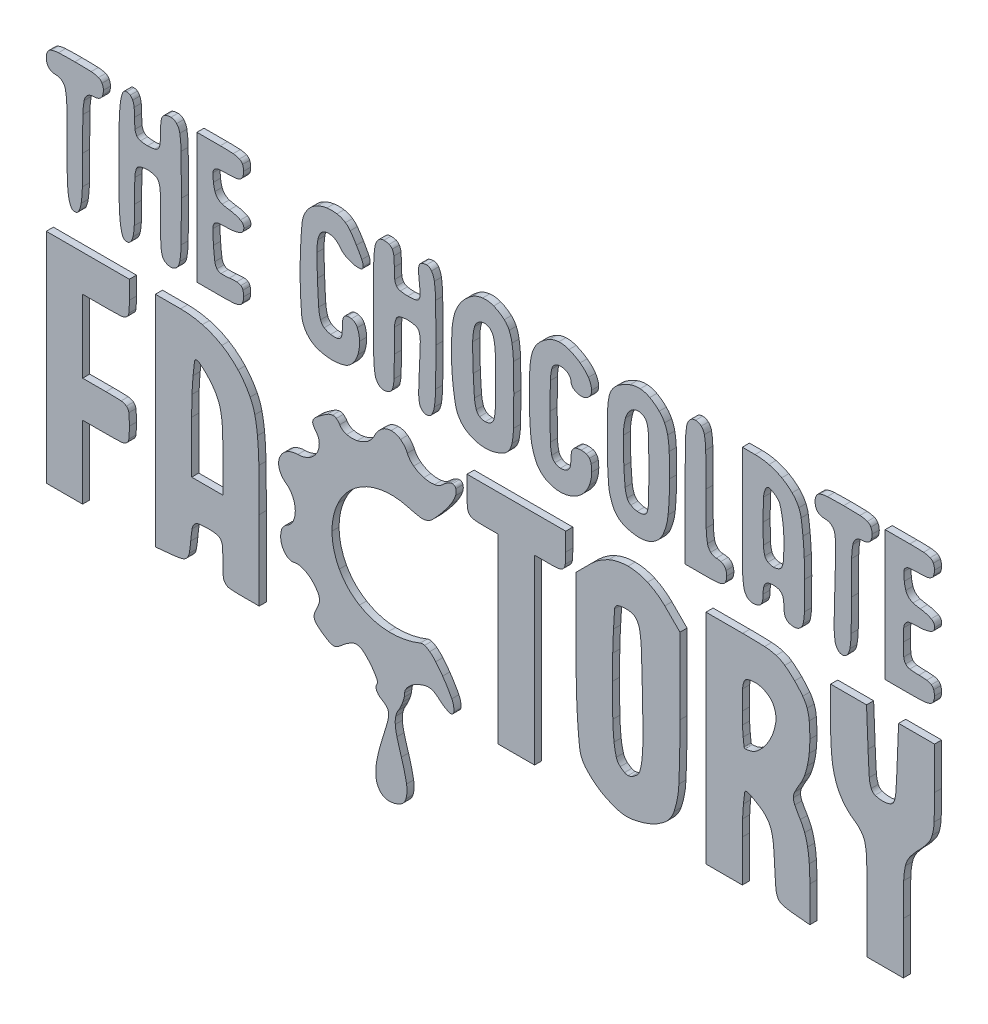
from build123d import *

# Parameters (mm, degrees)
BOSS_EXTRUDE2_DEPTH    = 2
BOSS_EXTRUDE2_2_DEPTH  = 2
BOSS_EXTRUDE2_3_DEPTH  = 2
BOSS_EXTRUDE2_4_DEPTH  = 2
BOSS_EXTRUDE2_5_DEPTH  = 2
BOSS_EXTRUDE2_6_DEPTH  = 2
BOSS_EXTRUDE2_7_DEPTH  = 2
BOSS_EXTRUDE2_8_DEPTH  = 2
BOSS_EXTRUDE2_9_DEPTH  = 2
BOSS_EXTRUDE2_10_DEPTH = 2
BOSS_EXTRUDE2_11_DEPTH = 2
BOSS_EXTRUDE2_12_DEPTH = 2
BOSS_EXTRUDE2_13_DEPTH = 2
BOSS_EXTRUDE2_14_DEPTH = 2
BOSS_EXTRUDE2_15_DEPTH = 2
BOSS_EXTRUDE2_16_DEPTH = 2
BOSS_EXTRUDE2_17_DEPTH = 2
BOSS_EXTRUDE2_18_DEPTH = 2
BOSS_EXTRUDE2_19_DEPTH = 2


with BuildPart() as part:
    # Sketch1 → Boss-Extrude2 (new body)
    with BuildSketch(Plane.XY):
        with BuildLine():
            Line((2678.288819125, 2844.248023646), (2678.288819125, 2825.972723646))
            Line((2678.288819125, 2825.972723646), (2684.867927125, 2825.972723646))
            ThreePointArc((2684.867927125, 2825.972723646), (2686.705799659, 2825.997939453), (2688.542288766, 2826.073563827))
            ThreePointArc((2688.542288766, 2826.073563827), (2689.435357497, 2826.207635518), (2690.287550675, 2826.506489602))
            ThreePointArc((2690.287550675, 2826.506489602), (2690.803627793, 2826.876680176), (2691.144692948, 2827.41245178))
            ThreePointArc((2691.144692948, 2827.41245178), (2691.370777518, 2828.192672942), (2691.447035125, 2829.001402855))
            ThreePointArc((2691.447035125, 2829.001402855), (2691.398714508, 2829.762852425), (2691.254528963, 2830.512085938))
            ThreePointArc((2691.254528963, 2830.512085938), (2691.032311929, 2830.982714993), (2690.653056675, 2831.339138295))
            ThreePointArc((2690.653056675, 2831.339138295), (2690.104768176, 2831.588206559), (2689.508942484, 2831.675653821))
            ThreePointArc((2689.508942484, 2831.675653821), (2688.465943673, 2831.649513325), (2687.426469125, 2831.559944855))
            ThreePointArc((2687.426469125, 2831.559944855), (2686.249657309, 2831.473028478), (2685.069720064, 2831.486761782))
            ThreePointArc((2685.069720064, 2831.486761782), (2684.4379681, 2831.660311181), (2683.935046161, 2832.080191476))
            ThreePointArc((2683.935046161, 2832.080191476), (2683.535671158, 2832.765614627), (2683.331733186, 2833.532240086))
            ThreePointArc((2683.331733186, 2833.532240086), (2683.118585575, 2835.41529167), (2682.956333669, 2837.303409646))
            ThreePointArc((2682.956333669, 2837.303409646), (2682.837493572, 2839.277310155), (2682.76642991, 2841.253507551))
            ThreePointArc((2682.76642991, 2841.253507551), (2682.86039905, 2841.997205883), (2683.169319863, 2842.680203203))
            ThreePointArc((2683.169319863, 2842.680203203), (2683.632735163, 2843.136282547), (2684.245872464, 2843.352672838))
            ThreePointArc((2684.245872464, 2843.352672838), (2685.608916054, 2843.475889581), (2686.976899669, 2843.517011646))
            ThreePointArc((2686.976899669, 2843.517011646), (2688.631470362, 2843.649685373), (2690.243758671, 2844.044315456))
            ThreePointArc((2690.243758671, 2844.044315456), (2691.09497715, 2844.637566529), (2691.484546275, 2845.599208682))
            ThreePointArc((2691.484546275, 2845.599208682), (2691.275948983, 2846.584488546), (2690.540644574, 2847.272686675))
            ThreePointArc((2690.540644574, 2847.272686675), (2689.021037392, 2847.851947112), (2687.426469125, 2848.171479088))
            ThreePointArc((2687.426469125, 2848.171479088), (2686.405218625, 2848.337811037), (2685.404033782, 2848.599053855))
            ThreePointArc((2685.404033782, 2848.599053855), (2684.72397269, 2848.905162846), (2684.136915125, 2849.365107646))
            ThreePointArc((2684.136915125, 2849.365107646), (2683.676970326, 2849.952165211), (2683.370861334, 2850.632226302))
            ThreePointArc((2683.370861334, 2850.632226302), (2683.109618516, 2851.633411146), (2682.943286567, 2852.654661646))
            ThreePointArc((2682.943286567, 2852.654661646), (2682.849547695, 2853.796328298), (2682.830475333, 2854.941678011))
            ThreePointArc((2682.830475333, 2854.941678011), (2682.953821172, 2855.525131062), (2683.287113675, 2856.019648774))
            ThreePointArc((2683.287113675, 2856.019648774), (2683.798931734, 2856.38033735), (2684.402244703, 2856.547870735))
            ThreePointArc((2684.402244703, 2856.547870735), (2685.681466671, 2856.643368203), (2686.963852567, 2856.675227646))
            ThreePointArc((2686.963852567, 2856.675227646), (2688.094210729, 2856.7084135), (2689.220675212, 2856.807855153))
            ThreePointArc((2689.220675212, 2856.807855153), (2689.898153337, 2856.968294041), (2690.52113094, 2857.279125431))
            ThreePointArc((2690.52113094, 2857.279125431), (2690.940384184, 2857.66526926), (2691.210510344, 2858.167177815))
            ThreePointArc((2691.210510344, 2858.167177815), (2691.387505931, 2858.873526376), (2691.447035125, 2859.599275646))
            ThreePointArc((2691.447035125, 2859.599275646), (2691.367726492, 2860.372359657), (2691.133103484, 2861.113238048))
            ThreePointArc((2691.133103484, 2861.113238048), (2690.779080014, 2861.636494025), (2690.259140625, 2861.995370697))
            ThreePointArc((2690.259140625, 2861.995370697), (2689.395396544, 2862.288940474), (2688.492891361, 2862.422062402))
            ThreePointArc((2688.492891361, 2862.422062402), (2686.681116249, 2862.498002524), (2684.867927125, 2862.523323646))
            Line((2684.867927125, 2862.523323646), (2678.288819125, 2862.523323646))
            Line((2678.288819125, 2862.523323646), (2678.288819125, 2844.248023646))
        make_face()
    extrude(amount=BOSS_EXTRUDE2_DEPTH)


with BuildPart() as body_2:
    # Sketch1 → Boss-Extrude2 2 (new body)
    with BuildSketch(Plane.XY):
        with BuildLine():
            Line((2815.719075125, 2844.248023646), (2815.719075125, 2825.972723646))
            Line((2815.719075125, 2825.972723646), (2821.567171125, 2825.972723646))
            ThreePointArc((2821.567171125, 2825.972723646), (2823.140409089, 2826.00007977), (2824.711744977, 2826.082113744))
            ThreePointArc((2824.711744977, 2826.082113744), (2825.536937269, 2826.222125229), (2826.318749125, 2826.520982646))
            ThreePointArc((2826.318749125, 2826.520982646), (2826.805117648, 2826.887478447), (2827.129026218, 2827.403188396))
            ThreePointArc((2827.129026218, 2827.403188396), (2827.343061258, 2828.136389446), (2827.415267125, 2828.896771646))
            ThreePointArc((2827.415267125, 2828.896771646), (2827.368663816, 2829.541760909), (2827.229822539, 2830.17335106))
            ThreePointArc((2827.229822539, 2830.17335106), (2827.01425505, 2830.665640218), (2826.684255125, 2831.089807646))
            ThreePointArc((2826.684255125, 2831.089807646), (2826.260087697, 2831.41980757), (2825.767798539, 2831.63537506))
            ThreePointArc((2825.767798539, 2831.63537506), (2825.136208389, 2831.774216337), (2824.491219125, 2831.820819646))
            ThreePointArc((2824.491219125, 2831.820819646), (2823.629854755, 2831.987551865), (2822.892924254, 2832.463662826))
            ThreePointArc((2822.892924254, 2832.463662826), (2822.319830994, 2833.21512108), (2822.002297246, 2834.105232146))
            ThreePointArc((2822.002297246, 2834.105232146), (2821.740183028, 2835.903237358), (2821.635146469, 2837.717209223))
            ThreePointArc((2821.635146469, 2837.717209223), (2821.584163682, 2842.444518249), (2821.567171125, 2847.172071646))
            ThreePointArc((2821.567171125, 2847.172071646), (2821.550178568, 2851.899625043), (2821.499195781, 2856.626934069))
            ThreePointArc((2821.499195781, 2856.626934069), (2821.394159222, 2858.440905934), (2821.132045004, 2860.238911146))
            ThreePointArc((2821.132045004, 2860.238911146), (2820.814511256, 2861.129022212), (2820.241417996, 2861.880480465))
            ThreePointArc((2820.241417996, 2861.880480465), (2819.504487495, 2862.356591426), (2818.643123125, 2862.523323646))
            ThreePointArc((2818.643123125, 2862.523323646), (2817.755079721, 2862.329271232), (2817.028921433, 2861.782488307))
            ThreePointArc((2817.028921433, 2861.782488307), (2816.453519524, 2860.889416949), (2816.143062085, 2859.873405146))
            ThreePointArc((2816.143062085, 2859.873405146), (2815.88554211, 2857.769911016), (2815.78355477, 2855.653167604))
            ThreePointArc((2815.78355477, 2855.653167604), (2815.735193776, 2849.950686767), (2815.719075125, 2844.248023646))
        make_face()
    extrude(amount=BOSS_EXTRUDE2_2_DEPTH)


with BuildPart() as body_3:
    # Sketch1 → Boss-Extrude2 3 (new body)
    with BuildSketch(Plane.XY):
        with BuildLine():
            Line((2835.38760651, 2862.523323646), (2831.801339125, 2862.523323646))
            Line((2831.801339125, 2862.523323646), (2831.801339125, 2844.248023646))
            ThreePointArc((2831.801339125, 2844.248023646), (2831.817457776, 2838.545360525), (2831.86581877, 2832.842879688))
            ThreePointArc((2831.86581877, 2832.842879688), (2831.96780611, 2830.726136275), (2832.225326085, 2828.622642146))
            ThreePointArc((2832.225326085, 2828.622642146), (2832.535783524, 2827.606630342), (2833.111185433, 2826.713558985))
            ThreePointArc((2833.111185433, 2826.713558985), (2833.837343721, 2826.16677606), (2834.725387125, 2825.972723646))
            ThreePointArc((2834.725387125, 2825.972723646), (2835.416969545, 2826.025131467), (2836.092756767, 2826.181158559))
            ThreePointArc((2836.092756767, 2826.181158559), (2836.588026516, 2826.420962814), (2836.991524325, 2826.795112146))
            ThreePointArc((2836.991524325, 2826.795112146), (2837.311303018, 2827.315583142), (2837.493776354, 2827.898551367))
            ThreePointArc((2837.493776354, 2827.898551367), (2837.610441703, 2828.759671644), (2837.649435125, 2829.627783646))
            ThreePointArc((2837.649435125, 2829.627783646), (2837.688428548, 2830.495895648), (2837.805093896, 2831.357015924))
            ThreePointArc((2837.805093896, 2831.357015924), (2837.987567233, 2831.93998415), (2838.307345925, 2832.460455146))
            ThreePointArc((2838.307345925, 2832.460455146), (2838.710843734, 2832.834604478), (2839.206113483, 2833.074408732))
            ThreePointArc((2839.206113483, 2833.074408732), (2839.881900705, 2833.230435825), (2840.573483125, 2833.282843646))
            ThreePointArc((2840.573483125, 2833.282843646), (2841.265065545, 2833.230435825), (2841.940852767, 2833.074408732))
            ThreePointArc((2841.940852767, 2833.074408732), (2842.436122516, 2832.834604478), (2842.839620325, 2832.460455146))
            ThreePointArc((2842.839620325, 2832.460455146), (2843.159399018, 2831.93998415), (2843.341872354, 2831.357015924))
            ThreePointArc((2843.341872354, 2831.357015924), (2843.458537703, 2830.495895648), (2843.497531125, 2829.627783646))
            ThreePointArc((2843.497531125, 2829.627783646), (2843.536524548, 2828.759671644), (2843.653189896, 2827.898551367))
            ThreePointArc((2843.653189896, 2827.898551367), (2843.835663233, 2827.315583142), (2844.155441925, 2826.795112146))
            ThreePointArc((2844.155441925, 2826.795112146), (2844.558939734, 2826.420962814), (2845.054209483, 2826.181158559))
            ThreePointArc((2845.054209483, 2826.181158559), (2845.729996705, 2826.025131467), (2846.421579125, 2825.972723646))
            ThreePointArc((2846.421579125, 2825.972723646), (2847.262585576, 2826.117416694), (2848.006878065, 2826.534857254))
            ThreePointArc((2848.006878065, 2826.534857254), (2848.574283602, 2827.179312679), (2848.898470009, 2827.974407021))
            ThreePointArc((2848.898470009, 2827.974407021), (2849.165352675, 2829.535160138), (2849.273749639, 2831.114852117))
            ThreePointArc((2849.273749639, 2831.114852117), (2849.327657216, 2835.088337059), (2849.345627125, 2839.062147031))
            ThreePointArc((2849.345627125, 2839.062147031), (2849.315853906, 2841.699100031), (2849.226548194, 2844.334708511))
            ThreePointArc((2849.226548194, 2844.334708511), (2849.080303364, 2846.84621793), (2848.868799694, 2849.353075188))
            ThreePointArc((2848.868799694, 2849.353075188), (2848.637006113, 2851.465200073), (2848.354031277, 2853.571078757))
            ThreePointArc((2848.354031277, 2853.571078757), (2848.113829318, 2854.664929086), (2847.722382815, 2855.71420272))
            ThreePointArc((2847.722382815, 2855.71420272), (2846.898215199, 2857.158014221), (2845.825911073, 2858.428450276))
            ThreePointArc((2845.825911073, 2858.428450276), (2844.438218108, 2859.621337961), (2842.900510701, 2860.613370581))
            ThreePointArc((2842.900510701, 2860.613370581), (2841.141086045, 2861.441964944), (2839.289972255, 2862.038221159))
            ThreePointArc((2839.289972255, 2862.038221159), (2837.353807428, 2862.401583792), (2835.38760651, 2862.523323646))
        make_face()
        with BuildLine():
            ThreePointArc((2842.423635022, 2853.768625978), (2842.156306977, 2854.387793534), (2841.743102325, 2854.920798846))
            ThreePointArc((2841.743102325, 2854.920798846), (2840.800968282, 2855.700382069), (2839.729578018, 2856.289864436))
            ThreePointArc((2839.729578018, 2856.289864436), (2839.009445254, 2856.31540975), (2838.463618746, 2855.844966147))
            ThreePointArc((2838.463618746, 2855.844966147), (2837.987642566, 2854.638158967), (2837.787409254, 2853.356424394))
            ThreePointArc((2837.787409254, 2853.356424394), (2837.683932054, 2850.265017501), (2837.649435125, 2847.172071646))
            ThreePointArc((2837.649435125, 2847.172071646), (2837.670049289, 2844.391326017), (2837.731891817, 2841.611191723))
            ThreePointArc((2837.731891817, 2841.611191723), (2837.849246916, 2840.403442365), (2838.127404397, 2839.222316146))
            ThreePointArc((2838.127404397, 2839.222316146), (2838.46610338, 2838.576309219), (2839.01490706, 2838.095833964))
            ThreePointArc((2839.01490706, 2838.095833964), (2839.765488891, 2837.777575371), (2840.573483125, 2837.668915646))
            ThreePointArc((2840.573483125, 2837.668915646), (2841.362553411, 2837.75985288), (2842.110253102, 2838.027895171))
            ThreePointArc((2842.110253102, 2838.027895171), (2842.644805741, 2838.431493917), (2842.994097781, 2839.003012546))
            ThreePointArc((2842.994097781, 2839.003012546), (2843.280546042, 2839.995188327), (2843.405730638, 2841.020270862))
            ThreePointArc((2843.405730638, 2841.020270862), (2843.474578567, 2843.218477793), (2843.497531125, 2845.417642846))
            ThreePointArc((2843.497531125, 2845.417642846), (2843.465325017, 2846.96658509), (2843.368763361, 2848.512849996))
            ThreePointArc((2843.368763361, 2848.512849996), (2843.211415925, 2849.964002054), (2842.982167665, 2851.405544891))
            ThreePointArc((2842.982167665, 2851.405544891), (2842.732172829, 2852.594003978), (2842.423635022, 2853.768625978))
        make_face(mode=Mode.SUBTRACT)
    extrude(amount=BOSS_EXTRUDE2_3_DEPTH)


with BuildPart() as body_4:
    # Sketch1 → Boss-Extrude2 4 (new body)
    with BuildSketch(Plane.XY):
        with BuildLine():
            Line((2872.006999125, 2844.248023646), (2872.006999125, 2825.972723646))
            Line((2872.006999125, 2825.972723646), (2878.951613125, 2825.972723646))
            ThreePointArc((2878.951613125, 2825.972723646), (2880.885199808, 2825.997205756), (2882.817546695, 2826.070638317))
            ThreePointArc((2882.817546695, 2826.070638317), (2883.758470109, 2826.200946387), (2884.662644375, 2826.492126678))
            ThreePointArc((2884.662644375, 2826.492126678), (2885.198940695, 2826.847714492), (2885.568287832, 2827.374629219))
            ThreePointArc((2885.568287832, 2827.374629219), (2885.813312324, 2828.118237501), (2885.896227125, 2828.896771646))
            ThreePointArc((2885.896227125, 2828.896771646), (2885.837560154, 2829.619206145), (2885.663095702, 2830.322708507))
            ThreePointArc((2885.663095702, 2830.322708507), (2885.396637327, 2830.823726961), (2884.982462125, 2831.211642492))
            ThreePointArc((2884.982462125, 2831.211642492), (2884.371204208, 2831.523445875), (2883.704531801, 2831.685943546))
            ThreePointArc((2883.704531801, 2831.685943546), (2882.609414014, 2831.787068569), (2881.510155125, 2831.820819646))
            ThreePointArc((2881.510155125, 2831.820819646), (2880.209073205, 2831.864999141), (2878.913985013, 2831.997334189))
            ThreePointArc((2878.913985013, 2831.997334189), (2878.271047815, 2832.22018326), (2877.763718625, 2832.673666492))
            ThreePointArc((2877.763718625, 2832.673666492), (2877.395515468, 2833.350277998), (2877.236365106, 2834.103967495))
            ThreePointArc((2877.236365106, 2834.103967495), (2877.152160844, 2835.885557687), (2877.124083125, 2837.668915646))
            ThreePointArc((2877.124083125, 2837.668915646), (2877.152160844, 2839.452273605), (2877.236365106, 2841.233863797))
            ThreePointArc((2877.236365106, 2841.233863797), (2877.395515468, 2841.987553293), (2877.763718625, 2842.6641648))
            ThreePointArc((2877.763718625, 2842.6641648), (2878.271047815, 2843.117648032), (2878.913985013, 2843.340497102))
            ThreePointArc((2878.913985013, 2843.340497102), (2880.209073205, 2843.47283215), (2881.510155125, 2843.517011646))
            ThreePointArc((2881.510155125, 2843.517011646), (2883.137799685, 2843.650791457), (2884.721756929, 2844.048539243))
            ThreePointArc((2884.721756929, 2844.048539243), (2885.557819127, 2844.644314967), (2885.928549552, 2845.601659035))
            ThreePointArc((2885.928549552, 2845.601659035), (2885.706601204, 2846.587197528), (2884.967112335, 2847.275458673))
            ThreePointArc((2884.967112335, 2847.275458673), (2883.459006595, 2847.853265005), (2881.875661125, 2848.171479088))
            ThreePointArc((2881.875661125, 2848.171479088), (2880.854410625, 2848.337811037), (2879.853225782, 2848.599053855))
            ThreePointArc((2879.853225782, 2848.599053855), (2879.17316469, 2848.905162846), (2878.586107125, 2849.365107646))
            ThreePointArc((2878.586107125, 2849.365107646), (2878.126162326, 2849.952165211), (2877.820053334, 2850.632226302))
            ThreePointArc((2877.820053334, 2850.632226302), (2877.558810516, 2851.633411146), (2877.392478567, 2852.654661646))
            ThreePointArc((2877.392478567, 2852.654661646), (2877.298739695, 2853.796328298), (2877.279667333, 2854.941678011))
            ThreePointArc((2877.279667333, 2854.941678011), (2877.403013172, 2855.525131062), (2877.736305675, 2856.019648774))
            ThreePointArc((2877.736305675, 2856.019648774), (2878.248123734, 2856.38033735), (2878.851436703, 2856.547870735))
            ThreePointArc((2878.851436703, 2856.547870735), (2880.130658671, 2856.643368203), (2881.413044567, 2856.675227646))
            ThreePointArc((2881.413044567, 2856.675227646), (2882.543402729, 2856.7084135), (2883.669867212, 2856.807855153))
            ThreePointArc((2883.669867212, 2856.807855153), (2884.347345337, 2856.968294041), (2884.97032294, 2857.279125431))
            ThreePointArc((2884.97032294, 2857.279125431), (2885.389576184, 2857.66526926), (2885.659702344, 2858.167177815))
            ThreePointArc((2885.659702344, 2858.167177815), (2885.836697931, 2858.873526376), (2885.896227125, 2859.599275646))
            ThreePointArc((2885.896227125, 2859.599275646), (2885.813312324, 2860.377809791), (2885.568287832, 2861.121418073))
            ThreePointArc((2885.568287832, 2861.121418073), (2885.198940695, 2861.648332799), (2884.662644375, 2862.003920614))
            ThreePointArc((2884.662644375, 2862.003920614), (2883.758470109, 2862.295100905), (2882.817546695, 2862.425408975))
            ThreePointArc((2882.817546695, 2862.425408975), (2880.885199808, 2862.498841536), (2878.951613125, 2862.523323646))
            Line((2878.951613125, 2862.523323646), (2872.006999125, 2862.523323646))
            Line((2872.006999125, 2862.523323646), (2872.006999125, 2844.248023646))
        make_face()
    extrude(amount=BOSS_EXTRUDE2_4_DEPTH)


with BuildPart() as body_5:
    # Sketch1 → Boss-Extrude2 5 (new body)
    with BuildSketch(Plane.XY):
        with BuildLine():
            Line((2635.890123125, 2786.498075646), (2635.890123125, 2755.795571646))
            Line((2635.890123125, 2755.795571646), (2641.007207125, 2755.795571646))
            Line((2641.007207125, 2755.795571646), (2646.124291125, 2755.795571646))
            Line((2646.124291125, 2755.795571646), (2646.124291125, 2766.029739646))
            Line((2646.124291125, 2766.029739646), (2646.124291125, 2776.263907646))
            Line((2646.124291125, 2776.263907646), (2652.703399125, 2776.263907646))
            ThreePointArc((2652.703399125, 2776.263907646), (2654.836742905, 2776.289549038), (2656.968854145, 2776.366456933))
            ThreePointArc((2656.968854145, 2776.366456933), (2657.750220494, 2776.525919197), (2658.447064213, 2776.913695441))
            ThreePointArc((2658.447064213, 2776.913695441), (2658.914952749, 2777.462160843), (2659.127550125, 2778.15102682))
            ThreePointArc((2659.127550125, 2778.15102682), (2659.243746214, 2779.764151763), (2659.282507125, 2781.380991646))
            ThreePointArc((2659.282507125, 2781.380991646), (2659.243746214, 2782.997831528), (2659.127550125, 2784.610956472))
            ThreePointArc((2659.127550125, 2784.610956472), (2658.914952749, 2785.299822449), (2658.447064213, 2785.848287851))
            ThreePointArc((2658.447064213, 2785.848287851), (2657.750220494, 2786.236064095), (2656.968854145, 2786.395526358))
            ThreePointArc((2656.968854145, 2786.395526358), (2654.836742905, 2786.472434254), (2652.703399125, 2786.498075646))
            Line((2652.703399125, 2786.498075646), (2646.124291125, 2786.498075646))
            Line((2646.124291125, 2786.498075646), (2646.124291125, 2796.732243646))
            Line((2646.124291125, 2796.732243646), (2646.124291125, 2806.966411646))
            Line((2646.124291125, 2806.966411646), (2652.703399125, 2806.966411646))
            ThreePointArc((2652.703399125, 2806.966411646), (2654.836742905, 2806.992053038), (2656.968854145, 2807.068960933))
            ThreePointArc((2656.968854145, 2807.068960933), (2657.750220494, 2807.228423197), (2658.447064213, 2807.616199441))
            ThreePointArc((2658.447064213, 2807.616199441), (2658.914952749, 2808.164664843), (2659.127550125, 2808.85353082))
            ThreePointArc((2659.127550125, 2808.85353082), (2659.243746214, 2810.466655763), (2659.282507125, 2812.083495646))
            Line((2659.282507125, 2812.083495646), (2659.282507125, 2817.200579646))
            Line((2659.282507125, 2817.200579646), (2647.586315125, 2817.200579646))
            Line((2647.586315125, 2817.200579646), (2635.890123125, 2817.200579646))
            Line((2635.890123125, 2817.200579646), (2635.890123125, 2786.498075646))
        make_face()
    extrude(amount=BOSS_EXTRUDE2_5_DEPTH)


with BuildPart() as body_6:
    # Sketch1 → Boss-Extrude2 6 (new body)
    with BuildSketch(Plane.XY):
        with BuildLine():
            Line((2666.592627125, 2786.405444729), (2666.592627125, 2755.610308351))
            Line((2666.592627125, 2755.610308351), (2671.344205125, 2756.068446729))
            ThreePointArc((2671.344205125, 2756.068446729), (2672.718087034, 2756.24681859), (2674.077220683, 2756.515377232))
            ThreePointArc((2674.077220683, 2756.515377232), (2674.810830535, 2756.811690377), (2675.418266583, 2757.318648306))
            ThreePointArc((2675.418266583, 2757.318648306), (2675.880405614, 2758.019012086), (2676.137006354, 2758.817910057))
            ThreePointArc((2676.137006354, 2758.817910057), (2676.379966832, 2760.408798698), (2676.549544204, 2762.009173646))
            ThreePointArc((2676.549544204, 2762.009173646), (2676.714705394, 2763.607531255), (2676.944895962, 2765.197826059))
            ThreePointArc((2676.944895962, 2765.197826059), (2677.180739059, 2765.955872438), (2677.613549714, 2766.621403214))
            ThreePointArc((2677.613549714, 2766.621403214), (2678.167998106, 2767.070753013), (2678.843204006, 2767.301892051))
            ThreePointArc((2678.843204006, 2767.301892051), (2680.068501716, 2767.444225114), (2681.301122204, 2767.491763646))
            ThreePointArc((2681.301122204, 2767.491763646), (2682.567697022, 2767.446417417), (2683.827786233, 2767.310611562))
            ThreePointArc((2683.827786233, 2767.310611562), (2684.464854, 2767.084098798), (2684.964819842, 2766.628909246))
            ThreePointArc((2684.964819842, 2766.628909246), (2685.329228307, 2765.947503047), (2685.487079669, 2765.191070047))
            ThreePointArc((2685.487079669, 2765.191070047), (2685.570966475, 2763.418250411), (2685.598939125, 2761.643667646))
            ThreePointArc((2685.598939125, 2761.643667646), (2685.628127065, 2759.79984207), (2685.715661273, 2757.957864205))
            ThreePointArc((2685.715661273, 2757.957864205), (2685.885939532, 2757.221318739), (2686.284262875, 2756.578798371))
            ThreePointArc((2686.284262875, 2756.578798371), (2686.848714728, 2756.13914119), (2687.536065368, 2755.940512319))
            ThreePointArc((2687.536065368, 2755.940512319), (2689.124393517, 2755.831825444), (2690.716023125, 2755.795571646))
            Line((2690.716023125, 2755.795571646), (2695.833107125, 2755.795571646))
            Line((2695.833107125, 2755.795571646), (2695.83083514, 2778.091437646))
            ThreePointArc((2695.83083514, 2778.091437646), (2695.804533221, 2784.070555576), (2695.726848683, 2790.049226676))
            ThreePointArc((2695.726848683, 2790.049226676), (2695.599154679, 2793.569474046), (2695.338042406, 2797.082345761))
            ThreePointArc((2695.338042406, 2797.082345761), (2695.037127029, 2799.464745589), (2694.582196467, 2801.822587227))
            ThreePointArc((2694.582196467, 2801.822587227), (2694.038101144, 2803.688671085), (2693.27229314, 2805.475245121))
            ThreePointArc((2693.27229314, 2805.475245121), (2691.747224225, 2808.049966124), (2689.881638718, 2810.389755462))
            ThreePointArc((2689.881638718, 2810.389755462), (2687.736489289, 2812.413323994), (2685.322246697, 2814.1068199))
            ThreePointArc((2685.322246697, 2814.1068199), (2682.655161769, 2815.456044657), (2679.823784964, 2816.413674468))
            ThreePointArc((2679.823784964, 2816.413674468), (2676.780282958, 2817.003052509), (2673.68653863, 2817.200579646))
            Line((2673.68653863, 2817.200579646), (2666.592627125, 2817.200579646))
            Line((2666.592627125, 2817.200579646), (2666.592627125, 2786.405444729))
        make_face()
        with BuildLine():
            Line((2685.598939125, 2788.493944551), (2685.598939125, 2777.725931646))
            Line((2685.598939125, 2777.725931646), (2681.212867125, 2777.725931646))
            Line((2681.212867125, 2777.725931646), (2676.826795125, 2777.725931646))
            Line((2676.826795125, 2777.725931646), (2676.826795125, 2792.346171646))
            ThreePointArc((2676.826795125, 2792.346171646), (2676.8511819, 2795.149442095), (2676.924332594, 2797.951864067))
            ThreePointArc((2676.924332594, 2797.951864067), (2677.040680965, 2800.313958749), (2677.225094323, 2802.671716146))
            ThreePointArc((2677.225094323, 2802.671716146), (2677.417801261, 2804.581867899), (2677.641303316, 2806.488661677))
            ThreePointArc((2677.641303316, 2806.488661677), (2677.821678572, 2806.829896851), (2678.182705423, 2806.966411646))
            ThreePointArc((2678.182705423, 2806.966411646), (2678.552667855, 2806.908628858), (2678.887390757, 2806.740784792))
            ThreePointArc((2678.887390757, 2806.740784792), (2679.470344188, 2806.30222965), (2680.030427437, 2805.83481969))
            ThreePointArc((2680.030427437, 2805.83481969), (2680.6858962, 2805.228500836), (2681.309248133, 2804.589208869))
            ThreePointArc((2681.309248133, 2804.589208869), (2681.953853735, 2803.864369464), (2682.568777423, 2803.114184551))
            ThreePointArc((2682.568777423, 2803.114184551), (2683.399821981, 2801.922376949), (2684.088349612, 2800.642935618))
            ThreePointArc((2684.088349612, 2800.642935618), (2684.623781309, 2799.295187395), (2684.999819234, 2797.89457758))
            ThreePointArc((2684.999819234, 2797.89457758), (2685.305740387, 2796.056567865), (2685.465894941, 2794.200168666))
            ThreePointArc((2685.465894941, 2794.200168666), (2685.565672907, 2791.34783199), (2685.598939125, 2788.493944551))
        make_face(mode=Mode.SUBTRACT)
    extrude(amount=BOSS_EXTRUDE2_6_DEPTH)


with BuildPart() as body_7:
    # Sketch1 → Boss-Extrude2 7 (new body)
    with BuildSketch(Plane.XY):
        with BuildLine():
            Line((2758.700139125, 2806.966411646), (2763.086211125, 2806.966411646))
            Line((2763.086211125, 2806.966411646), (2763.086211125, 2781.380991646))
            Line((2763.086211125, 2781.380991646), (2763.086211125, 2755.795571646))
            Line((2763.086211125, 2755.795571646), (2768.203295125, 2755.795571646))
            Line((2768.203295125, 2755.795571646), (2773.320379125, 2755.795571646))
            Line((2773.320379125, 2755.795571646), (2773.320379125, 2781.380991646))
            Line((2773.320379125, 2781.380991646), (2773.320379125, 2806.966411646))
            Line((2773.320379125, 2806.966411646), (2777.706451125, 2806.966411646))
            ThreePointArc((2777.706451125, 2806.966411646), (2778.980893384, 2807.007305949), (2780.250092176, 2807.129820606))
            ThreePointArc((2780.250092176, 2807.129820606), (2780.890220696, 2807.336123925), (2781.41372585, 2807.7583418))
            ThreePointArc((2781.41372585, 2807.7583418), (2781.79178412, 2808.371083564), (2781.963772906, 2809.070226169))
            ThreePointArc((2781.963772906, 2809.070226169), (2782.060320694, 2810.575486241), (2782.092523125, 2812.083495646))
            Line((2782.092523125, 2812.083495646), (2782.092523125, 2817.200579646))
            Line((2782.092523125, 2817.200579646), (2768.203295125, 2817.200579646))
            Line((2768.203295125, 2817.200579646), (2754.314067125, 2817.200579646))
            Line((2754.314067125, 2817.200579646), (2754.314067125, 2812.083495646))
            ThreePointArc((2754.314067125, 2812.083495646), (2754.346269557, 2810.575486241), (2754.442817345, 2809.070226169))
            ThreePointArc((2754.442817345, 2809.070226169), (2754.61480613, 2808.371083564), (2754.9928644, 2807.7583418))
            ThreePointArc((2754.9928644, 2807.7583418), (2755.516369555, 2807.336123925), (2756.156498074, 2807.129820606))
            ThreePointArc((2756.156498074, 2807.129820606), (2757.425696866, 2807.007305949), (2758.700139125, 2806.966411646))
        make_face()
    extrude(amount=BOSS_EXTRUDE2_7_DEPTH)


with BuildPart() as body_8:
    # Sketch1 → Boss-Extrude2 8 (new body)
    with BuildSketch(Plane.XY):
        with BuildLine():
            Line((2789.290179853, 2812.926970918), (2785.016571125, 2808.65336219))
            Line((2785.016571125, 2808.65336219), (2785.016571125, 2788.141355533))
            ThreePointArc((2785.016571125, 2788.141355533), (2785.044819286, 2783.861853366), (2785.129551954, 2779.583096872))
            ThreePointArc((2785.129551954, 2779.583096872), (2785.264568627, 2775.935119291), (2785.476839673, 2772.290820875))
            ThreePointArc((2785.476839673, 2772.290820875), (2785.704299112, 2769.396486161), (2785.987588985, 2766.50708171))
            ThreePointArc((2785.987588985, 2766.50708171), (2786.232871809, 2765.213702938), (2786.681168784, 2763.975954122))
            ThreePointArc((2786.681168784, 2763.975954122), (2787.127519983, 2763.153535874), (2787.68384385, 2762.401136432))
            ThreePointArc((2787.68384385, 2762.401136432), (2788.494290717, 2761.513208657), (2789.362213775, 2760.681373683))
            ThreePointArc((2789.362213775, 2760.681373683), (2790.348675042, 2759.853099987), (2791.38656437, 2759.09025735))
            ThreePointArc((2791.38656437, 2759.09025735), (2792.404814512, 2758.449160291), (2793.470609405, 2757.890662272))
            ThreePointArc((2793.470609405, 2757.890662272), (2794.899824653, 2757.260901082), (2796.362079124, 2756.712205137))
            ThreePointArc((2796.362079124, 2756.712205137), (2797.497271828, 2756.401894855), (2798.662826819, 2756.239301778))
            ThreePointArc((2798.662826819, 2756.239301778), (2799.842748682, 2756.226723931), (2801.014670789, 2756.364464191))
            ThreePointArc((2801.014670789, 2756.364464191), (2802.553391101, 2756.689847271), (2804.071841923, 2757.099531845))
            ThreePointArc((2804.071841923, 2757.099531845), (2806.952399009, 2758.252482474), (2809.581230823, 2759.900556374))
            ThreePointArc((2809.581230823, 2759.900556374), (2811.40088333, 2761.768757391), (2812.592030941, 2764.088774128))
            ThreePointArc((2812.592030941, 2764.088774128), (2813.536697021, 2767.732118298), (2813.951179622, 2771.473047985))
            ThreePointArc((2813.951179622, 2771.473047985), (2814.180575064, 2779.380101673), (2814.257051125, 2787.290112528))
            Line((2814.257051125, 2787.290112528), (2814.257051125, 2808.65336219))
            Line((2814.257051125, 2808.65336219), (2809.983442397, 2812.926970918))
            ThreePointArc((2809.983442397, 2812.926970918), (2807.70846466, 2814.820397727), (2805.127546061, 2816.269344921))
            ThreePointArc((2805.127546061, 2816.269344921), (2802.443930077, 2817.144421116), (2799.636811125, 2817.440455386))
            ThreePointArc((2799.636811125, 2817.440455386), (2796.829692174, 2817.144421116), (2794.146076189, 2816.269344921))
            ThreePointArc((2794.146076189, 2816.269344921), (2791.56515759, 2814.820397727), (2789.290179853, 2812.926970918))
        make_face()
        with BuildLine():
            ThreePointArc((2803.829064065, 2777.970905463), (2803.786254071, 2782.890011194), (2803.699460024, 2787.808537466))
            ThreePointArc((2803.699460024, 2787.808537466), (2803.556444059, 2793.487423287), (2803.378642249, 2799.165326442))
            ThreePointArc((2803.378642249, 2799.165326442), (2803.223187453, 2801.373806992), (2802.909671735, 2803.565441183))
            ThreePointArc((2802.909671735, 2803.565441183), (2802.568451917, 2804.681484394), (2801.974295096, 2805.685954944))
            ThreePointArc((2801.974295096, 2805.685954944), (2801.236883105, 2806.337932702), (2800.307659375, 2806.662578204))
            ThreePointArc((2800.307659375, 2806.662578204), (2799.699983209, 2806.727675953), (2799.089221732, 2806.749549626))
            ThreePointArc((2799.089221732, 2806.749549626), (2798.490735709, 2806.727192389), (2797.895631187, 2806.659842757))
            ThreePointArc((2797.895631187, 2806.659842757), (2797.388360136, 2806.561752047), (2796.890727996, 2806.422798958))
            ThreePointArc((2796.890727996, 2806.422798958), (2796.566992646, 2806.273916363), (2796.287093375, 2806.05340105))
            ThreePointArc((2796.287093375, 2806.05340105), (2795.996683154, 2805.634788512), (2795.871251351, 2805.140985498))
            ThreePointArc((2795.871251351, 2805.140985498), (2795.703677039, 2802.609723388), (2795.55516761, 2800.077271222))
            ThreePointArc((2795.55516761, 2800.077271222), (2795.415620945, 2797.080279698), (2795.325732184, 2794.081387988))
            ThreePointArc((2795.325732184, 2794.081387988), (2795.269487251, 2790.623114273), (2795.250739125, 2787.164434021))
            ThreePointArc((2795.250739125, 2787.164434021), (2795.274122033, 2782.566271033), (2795.344275035, 2777.968583769))
            ThreePointArc((2795.344275035, 2777.968583769), (2795.460305678, 2775.272564818), (2795.69840795, 2772.584575123))
            ThreePointArc((2795.69840795, 2772.584575123), (2795.952648188, 2770.890490373), (2796.334603307, 2769.220558779))
            ThreePointArc((2796.334603307, 2769.220558779), (2796.755171289, 2768.270177104), (2797.443775125, 2767.491763646))
            ThreePointArc((2797.443775125, 2767.491763646), (2798.031048706, 2767.04846117), (2798.656664387, 2766.661146875))
            ThreePointArc((2798.656664387, 2766.661146875), (2799.13456984, 2766.470716549), (2799.645248466, 2766.408550064))
            ThreePointArc((2799.645248466, 2766.408550064), (2800.159218289, 2766.478348027), (2800.639123609, 2766.675141369))
            ThreePointArc((2800.639123609, 2766.675141369), (2801.274324325, 2767.073702068), (2801.871930024, 2767.526689937))
            ThreePointArc((2801.871930024, 2767.526689937), (2802.579050385, 2768.325414423), (2803.011865751, 2769.300427688))
            ThreePointArc((2803.011865751, 2769.300427688), (2803.376324129, 2770.924730803), (2803.59787421, 2772.57461143))
            ThreePointArc((2803.59787421, 2772.57461143), (2803.776951141, 2775.270038729), (2803.829064065, 2777.970905463))
        make_face(mode=Mode.SUBTRACT)
    extrude(amount=BOSS_EXTRUDE2_8_DEPTH)


with BuildPart() as body_9:
    # Sketch1 → Boss-Extrude2 9 (new body)
    with BuildSketch(Plane.XY):
        with BuildLine():
            Line((2821.567171125, 2786.498075646), (2821.567171125, 2755.795571646))
            Line((2821.567171125, 2755.795571646), (2826.684255125, 2755.795571646))
            Line((2826.684255125, 2755.795571646), (2831.801339125, 2755.795571646))
            Line((2831.801339125, 2755.795571646), (2831.801339125, 2767.491763646))
            ThreePointArc((2831.801339125, 2767.491763646), (2831.821785602, 2769.734395856), (2831.883117438, 2771.976282494))
            ThreePointArc((2831.883117438, 2771.976282494), (2831.98066577, 2773.866145096), (2832.135249324, 2775.752199246))
            ThreePointArc((2832.135249324, 2775.752199246), (2832.296608886, 2777.273102999), (2832.484757858, 2778.790925484))
            ThreePointArc((2832.484757858, 2778.790925484), (2832.63676089, 2779.074664095), (2832.938054013, 2779.187955646))
            ThreePointArc((2832.938054013, 2779.187955646), (2833.2581422, 2779.155265505), (2833.565013765, 2779.058544591))
            ThreePointArc((2833.565013765, 2779.058544591), (2834.124616959, 2778.805668211), (2834.675128588, 2778.533566862))
            ThreePointArc((2834.675128588, 2778.533566862), (2835.321270199, 2778.185047992), (2835.954235841, 2777.813135529))
            ThreePointArc((2835.954235841, 2777.813135529), (2836.611305352, 2777.396694737), (2837.255261759, 2776.960250671))
            ThreePointArc((2837.255261759, 2776.960250671), (2838.129715766, 2776.236815193), (2838.877479728, 2775.383071812))
            ThreePointArc((2838.877479728, 2775.383071812), (2839.471056036, 2774.429070615), (2839.899697668, 2773.390457372))
            ThreePointArc((2839.899697668, 2773.390457372), (2840.280995554, 2771.939269826), (2840.50992748, 2770.456393046))
            ThreePointArc((2840.50992748, 2770.456393046), (2840.722373166, 2768.045392721), (2840.870124871, 2765.629564671))
            ThreePointArc((2840.870124871, 2765.629564671), (2841.035050297, 2762.635799665), (2841.2439878, 2759.644784047))
            ThreePointArc((2841.2439878, 2759.644784047), (2841.437230756, 2758.595162191), (2841.844980543, 2757.608861532))
            ThreePointArc((2841.844980543, 2757.608861532), (2842.38225191, 2756.971109458), (2843.127796952, 2756.597544443))
            ThreePointArc((2843.127796952, 2756.597544443), (2844.58099806, 2756.272465189), (2846.056073125, 2756.068446729))
            Line((2846.056073125, 2756.068446729), (2850.807651125, 2755.610308351))
            Line((2850.807651125, 2755.610308351), (2850.802186079, 2765.571602729))
            ThreePointArc((2850.802186079, 2765.571602729), (2850.763132982, 2767.987199098), (2850.648658939, 2770.400397527))
            ThreePointArc((2850.648658939, 2770.400397527), (2850.468812755, 2772.321208795), (2850.17281545, 2774.227578688))
            ThreePointArc((2850.17281545, 2774.227578688), (2849.81902712, 2775.794501191), (2849.348261692, 2777.330337192))
            ThreePointArc((2849.348261692, 2777.330337192), (2848.805940896, 2778.657023678), (2848.12645116, 2779.918967646))
            ThreePointArc((2848.12645116, 2779.918967646), (2847.320752923, 2781.301411006), (2846.568686518, 2782.71374787))
            ThreePointArc((2846.568686518, 2782.71374787), (2846.284139365, 2783.486894896), (2846.187378963, 2784.305039646))
            ThreePointArc((2846.187378963, 2784.305039646), (2846.283733899, 2785.123165603), (2846.567918955, 2785.896375283))
            ThreePointArc((2846.567918955, 2785.896375283), (2847.319237936, 2787.308684719), (2848.124218649, 2788.691111646))
            ThreePointArc((2848.124218649, 2788.691111646), (2848.748556611, 2789.843820539), (2849.254437764, 2791.053208791))
            ThreePointArc((2849.254437764, 2791.053208791), (2849.722592943, 2792.496590712), (2850.096209778, 2793.967281401))
            ThreePointArc((2850.096209778, 2793.967281401), (2850.408226323, 2795.618047549), (2850.622229931, 2797.284356541))
            ThreePointArc((2850.622229931, 2797.284356541), (2850.754610627, 2799.072654854), (2850.799953569, 2800.865272918))
            ThreePointArc((2850.799953569, 2800.865272918), (2850.75924505, 2803.048560891), (2850.632863232, 2805.228568046))
            ThreePointArc((2850.632863232, 2805.228568046), (2850.42862413, 2806.645644418), (2850.040750822, 2808.023821966))
            ThreePointArc((2850.040750822, 2808.023821966), (2849.510141891, 2809.221725594), (2848.801996893, 2810.324018477))
            ThreePointArc((2848.801996893, 2810.324018477), (2847.712721449, 2811.664443414), (2846.534042397, 2812.926970918))
            ThreePointArc((2846.534042397, 2812.926970918), (2845.187604531, 2814.176729056), (2843.751945231, 2815.322884678))
            ThreePointArc((2843.751945231, 2815.322884678), (2842.585360276, 2816.035685705), (2841.311958758, 2816.533133525))
            ThreePointArc((2841.311958758, 2816.533133525), (2839.707768858, 2816.898650177), (2838.071236359, 2817.068323493))
            ThreePointArc((2838.071236359, 2817.068323493), (2834.993229462, 2817.167510832), (2831.913802397, 2817.200579646))
            Line((2831.913802397, 2817.200579646), (2821.567171125, 2817.200579646))
            Line((2821.567171125, 2817.200579646), (2821.567171125, 2786.498075646))
        make_face()
        with BuildLine():
            ThreePointArc((2841.201972154, 2800.030384113), (2841.187912471, 2802.166026079), (2840.496278024, 2804.186621554))
            ThreePointArc((2840.496278024, 2804.186621554), (2840.120730955, 2804.765144765), (2839.653351011, 2805.272373209))
            ThreePointArc((2839.653351011, 2805.272373209), (2839.05426514, 2805.758172114), (2838.400894993, 2806.168064668))
            ThreePointArc((2838.400894993, 2806.168064668), (2837.678181654, 2806.509381104), (2836.920547446, 2806.763943252))
            ThreePointArc((2836.920547446, 2806.763943252), (2836.169485433, 2806.915570756), (2835.404959273, 2806.966411646))
            ThreePointArc((2835.404959273, 2806.966411646), (2834.363524828, 2806.887671594), (2833.345768646, 2806.653240257))
            ThreePointArc((2833.345768646, 2806.653240257), (2832.726154133, 2806.297117459), (2832.316996452, 2805.71116901))
            ThreePointArc((2832.316996452, 2805.71116901), (2832.007501215, 2804.709732169), (2831.882386426, 2803.669054824))
            ThreePointArc((2831.882386426, 2803.669054824), (2831.821603325, 2800.93196115), (2831.801339125, 2798.194267646))
            ThreePointArc((2831.801339125, 2798.194267646), (2831.816215185, 2796.512301161), (2831.860840578, 2794.830860966))
            ThreePointArc((2831.860840578, 2794.830860966), (2831.931816569, 2793.413556136), (2832.044308508, 2791.998940946))
            ThreePointArc((2832.044308508, 2791.998940946), (2832.161812163, 2790.854750924), (2832.29835126, 2789.712676061))
            ThreePointArc((2832.29835126, 2789.712676061), (2832.408581847, 2789.505107689), (2832.628466045, 2789.422123646))
            ThreePointArc((2832.628466045, 2789.422123646), (2834.600332164, 2789.790350523), (2836.306414031, 2790.845401086))
            ThreePointArc((2836.306414031, 2790.845401086), (2838.08540488, 2792.767861492), (2839.510505418, 2794.96553092))
            ThreePointArc((2839.510505418, 2794.96553092), (2840.568565029, 2797.427048694), (2841.201972154, 2800.030384113))
        make_face(mode=Mode.SUBTRACT)
    extrude(amount=BOSS_EXTRUDE2_9_DEPTH)


with BuildPart() as body_10:
    # Sketch1 → Boss-Extrude2 10 (new body)
    with BuildSketch(Plane.XY):
        with BuildLine():
            Line((2866.889915125, 2770.382107607), (2866.889915125, 2755.795571646))
            Line((2866.889915125, 2755.795571646), (2872.006999125, 2755.795571646))
            Line((2872.006999125, 2755.795571646), (2877.124083125, 2755.795571646))
            Line((2877.124083125, 2755.795571646), (2877.124083125, 2770.303348374))
            ThreePointArc((2877.124083125, 2770.303348374), (2877.148772293, 2774.935416964), (2877.22284577, 2779.566959051))
            ThreePointArc((2877.22284577, 2779.566959051), (2877.366065508, 2781.524918674), (2877.710593059, 2783.457641763))
            ThreePointArc((2877.710593059, 2783.457641763), (2878.186084064, 2784.863017843), (2878.926536489, 2786.148670916))
            ThreePointArc((2878.926536489, 2786.148670916), (2880.155541595, 2787.726160428), (2881.510155125, 2789.197197102))
            ThreePointArc((2881.510155125, 2789.197197102), (2882.826946653, 2790.615942855), (2884.034478453, 2792.128770139))
            ThreePointArc((2884.034478453, 2792.128770139), (2884.764911436, 2793.337941605), (2885.2592028, 2794.661310042))
            ThreePointArc((2885.2592028, 2794.661310042), (2885.619387496, 2796.380730095), (2885.778167225, 2798.130280703))
            ThreePointArc((2885.778167225, 2798.130280703), (2885.866708495, 2801.760622743), (2885.896227125, 2805.391924374))
            Line((2885.896227125, 2805.391924374), (2885.896227125, 2817.200579646))
            Line((2885.896227125, 2817.200579646), (2880.843194397, 2817.200579646))
            Line((2880.843194397, 2817.200579646), (2875.790160206, 2817.200579646))
            Line((2875.790160206, 2817.200579646), (2875.360604397, 2806.600905646))
            ThreePointArc((2875.360604397, 2806.600905646), (2875.205131133, 2803.238080916), (2875.011353179, 2799.877245871))
            ThreePointArc((2875.011353179, 2799.877245871), (2874.839601391, 2798.653348017), (2874.48420142, 2797.469660773))
            ThreePointArc((2874.48420142, 2797.469660773), (2874.050249882, 2796.806599761), (2873.382196444, 2796.380373944))
            ThreePointArc((2873.382196444, 2796.380373944), (2872.346018213, 2796.096773186), (2871.275987125, 2796.001231646))
            ThreePointArc((2871.275987125, 2796.001231646), (2870.205956037, 2796.096773186), (2869.169777806, 2796.380373944))
            ThreePointArc((2869.169777806, 2796.380373944), (2868.501724368, 2796.806599761), (2868.06777283, 2797.469660773))
            ThreePointArc((2868.06777283, 2797.469660773), (2867.712372859, 2798.653348017), (2867.540621071, 2799.877245871))
            ThreePointArc((2867.540621071, 2799.877245871), (2867.346843117, 2803.238080916), (2867.191369854, 2806.600905646))
            Line((2867.191369854, 2806.600905646), (2866.761814044, 2817.200579646))
            Line((2866.761814044, 2817.200579646), (2861.708779854, 2817.200579646))
            Line((2861.708779854, 2817.200579646), (2856.655747125, 2817.200579646))
            Line((2856.655747125, 2817.200579646), (2856.655747125, 2807.035204261))
            ThreePointArc((2856.655747125, 2807.035204261), (2856.744286956, 2803.245455778), (2857.00971337, 2799.463977009))
            ThreePointArc((2857.00971337, 2799.463977009), (2857.428361767, 2796.744666733), (2858.165931658, 2794.094024262))
            ThreePointArc((2858.165931658, 2794.094024262), (2859.055069398, 2792.056453821), (2860.260264955, 2790.188363114))
            ThreePointArc((2860.260264955, 2790.188363114), (2861.73469581, 2788.566986663), (2863.460191036, 2787.215885569))
            ThreePointArc((2863.460191036, 2787.215885569), (2864.501346218, 2786.392660653), (2865.380300782, 2785.398104345))
            ThreePointArc((2865.380300782, 2785.398104345), (2866.004052324, 2784.324518363), (2866.382157114, 2783.141856275))
            ThreePointArc((2866.382157114, 2783.141856275), (2866.679587929, 2781.245294584), (2866.803708342, 2779.329568753))
            ThreePointArc((2866.803708342, 2779.329568753), (2866.868361694, 2774.856045809), (2866.889915125, 2770.382107607))
        make_face()
    extrude(amount=BOSS_EXTRUDE2_10_DEPTH)


with BuildPart() as body_11:
    # Sketch1 → Boss-Extrude2 11 (new body)
    with BuildSketch(Plane.XY):
        with BuildLine():
            ThreePointArc((2635.890123125, 2859.599275646), (2635.936726434, 2858.954286382), (2636.075567711, 2858.322696232))
            ThreePointArc((2636.075567711, 2858.322696232), (2636.291135201, 2857.830407074), (2636.621135125, 2857.406239646))
            ThreePointArc((2636.621135125, 2857.406239646), (2637.045302553, 2857.076239721), (2637.537591711, 2856.860672232))
            ThreePointArc((2637.537591711, 2856.860672232), (2638.169181862, 2856.721830954), (2638.814171125, 2856.675227646))
            ThreePointArc((2638.814171125, 2856.675227646), (2639.675535495, 2856.508495426), (2640.412465996, 2856.032384465))
            ThreePointArc((2640.412465996, 2856.032384465), (2640.985559256, 2855.280926212), (2641.303093004, 2854.390815146))
            ThreePointArc((2641.303093004, 2854.390815146), (2641.565207222, 2852.592809934), (2641.670243781, 2850.778838069))
            ThreePointArc((2641.670243781, 2850.778838069), (2641.721226568, 2846.051529043), (2641.738219125, 2841.323975646))
            ThreePointArc((2641.738219125, 2841.323975646), (2641.758177951, 2837.200912006), (2641.818054408, 2833.078234849))
            ThreePointArc((2641.818054408, 2833.078234849), (2641.92293084, 2830.982326336), (2642.15593985, 2828.896771646))
            ThreePointArc((2642.15593985, 2828.896771646), (2642.400795411, 2827.771723827), (2642.805429392, 2826.693782186))
            ThreePointArc((2642.805429392, 2826.693782186), (2643.931255105, 2825.97272369), (2645.057080858, 2826.693782123))
            ThreePointArc((2645.057080858, 2826.693782123), (2645.461714839, 2827.771723764), (2645.7065704, 2828.896771582))
            ThreePointArc((2645.7065704, 2828.896771582), (2645.93957941, 2830.982326272), (2646.044455843, 2833.078234785))
            ThreePointArc((2646.044455843, 2833.078234785), (2646.104332299, 2837.200911942), (2646.124291125, 2841.323975582))
            ThreePointArc((2646.124291125, 2841.323975582), (2646.141283682, 2846.051529011), (2646.192266469, 2850.778838069))
            ThreePointArc((2646.192266469, 2850.778838069), (2646.297303028, 2852.592809934), (2646.559417246, 2854.390815146))
            ThreePointArc((2646.559417246, 2854.390815146), (2646.876950994, 2855.280926212), (2647.450044254, 2856.032384465))
            ThreePointArc((2647.450044254, 2856.032384465), (2648.186974755, 2856.508495426), (2649.048339125, 2856.675227646))
            ThreePointArc((2649.048339125, 2856.675227646), (2649.693328389, 2856.721830954), (2650.324918539, 2856.860672232))
            ThreePointArc((2650.324918539, 2856.860672232), (2650.817207697, 2857.076239721), (2651.241375125, 2857.406239646))
            ThreePointArc((2651.241375125, 2857.406239646), (2651.57137505, 2857.830407074), (2651.786942539, 2858.322696232))
            ThreePointArc((2651.786942539, 2858.322696232), (2651.925783816, 2858.954286382), (2651.972387125, 2859.599275646))
            ThreePointArc((2651.972387125, 2859.599275646), (2651.878511557, 2860.391805042), (2651.602079838, 2861.140471169))
            ThreePointArc((2651.602079838, 2861.140471169), (2651.185859007, 2861.67763963), (2650.601739625, 2862.024906506))
            ThreePointArc((2650.601739625, 2862.024906506), (2649.577823203, 2862.309794316), (2648.522225403, 2862.433403322))
            ThreePointArc((2648.522225403, 2862.433403322), (2646.227180514, 2862.500840874), (2643.931255125, 2862.523323646))
            ThreePointArc((2643.931255125, 2862.523323646), (2641.635329736, 2862.500840874), (2639.340284848, 2862.433403322))
            ThreePointArc((2639.340284848, 2862.433403322), (2638.284687047, 2862.309794316), (2637.260770625, 2862.024906506))
            ThreePointArc((2637.260770625, 2862.024906506), (2636.676651243, 2861.67763963), (2636.260430412, 2861.140471169))
            ThreePointArc((2636.260430412, 2861.140471169), (2635.983998693, 2860.391805042), (2635.890123125, 2859.599275646))
        make_face()
    extrude(amount=BOSS_EXTRUDE2_11_DEPTH)


with BuildPart() as body_12:
    # Sketch1 → Boss-Extrude2 12 (new body)
    with BuildSketch(Plane.XY):
        with BuildLine():
            ThreePointArc((2656.358459125, 2844.248023646), (2656.377682912, 2839.276823046), (2656.435352815, 2834.305919794))
            ThreePointArc((2656.435352815, 2834.305919794), (2656.537615679, 2831.840694659), (2656.767825845, 2829.384112492))
            ThreePointArc((2656.767825845, 2829.384112492), (2657.007527402, 2828.058256408), (2657.402758014, 2826.770178789))
            ThreePointArc((2657.402758014, 2826.770178789), (2657.85229334, 2826.191628484), (2658.551495125, 2825.972723646))
            ThreePointArc((2658.551495125, 2825.972723646), (2659.156042848, 2826.118690713), (2659.627382504, 2826.524428636))
            ThreePointArc((2659.627382504, 2826.524428636), (2660.042584008, 2827.249373453), (2660.300703037, 2828.0439248))
            ThreePointArc((2660.300703037, 2828.0439248), (2660.541822139, 2829.476278441), (2660.655199997, 2830.924353314))
            ThreePointArc((2660.655199997, 2830.924353314), (2660.722197492, 2833.565244832), (2660.744531125, 2836.206891646))
            ThreePointArc((2660.744531125, 2836.206891646), (2660.762891318, 2839.486123934), (2660.817970053, 2842.764945038))
            ThreePointArc((2660.817970053, 2842.764945038), (2660.937408811, 2843.925514675), (2661.2405754, 2845.052136846))
            ThreePointArc((2661.2405754, 2845.052136846), (2661.646291929, 2845.689230819), (2662.287963545, 2846.087667977))
            ThreePointArc((2662.287963545, 2846.087667977), (2663.329093911, 2846.352101937), (2664.399591125, 2846.441059646))
            ThreePointArc((2664.399591125, 2846.441059646), (2665.470088339, 2846.352101937), (2666.511218705, 2846.087667977))
            ThreePointArc((2666.511218705, 2846.087667977), (2667.152890321, 2845.689230819), (2667.55860685, 2845.052136846))
            ThreePointArc((2667.55860685, 2845.052136846), (2667.861773439, 2843.925514675), (2667.981212198, 2842.764945038))
            ThreePointArc((2667.981212198, 2842.764945038), (2668.036290932, 2839.486123934), (2668.054651125, 2836.206891646))
            ThreePointArc((2668.054651125, 2836.206891646), (2668.074557887, 2833.183283103), (2668.134270028, 2830.160198692))
            ThreePointArc((2668.134270028, 2830.160198692), (2668.249238693, 2828.876540015), (2668.524588037, 2827.617500646))
            ThreePointArc((2668.524588037, 2827.617500646), (2668.859738816, 2826.940988359), (2669.413440148, 2826.427753761))
            ThreePointArc((2669.413440148, 2826.427753761), (2670.163670127, 2826.088787569), (2670.978699125, 2825.972723646))
            ThreePointArc((2670.978699125, 2825.972723646), (2671.866742529, 2826.16677606), (2672.592900817, 2826.713558985))
            ThreePointArc((2672.592900817, 2826.713558985), (2673.168302726, 2827.606630342), (2673.478760165, 2828.622642146))
            ThreePointArc((2673.478760165, 2828.622642146), (2673.73628014, 2830.726136275), (2673.838267481, 2832.842879688))
            ThreePointArc((2673.838267481, 2832.842879688), (2673.886628474, 2838.545360525), (2673.902747125, 2844.248023646))
            ThreePointArc((2673.902747125, 2844.248023646), (2673.886628474, 2849.950686767), (2673.838267481, 2855.653167604))
            ThreePointArc((2673.838267481, 2855.653167604), (2673.73628014, 2857.769911016), (2673.478760165, 2859.873405146))
            ThreePointArc((2673.478760165, 2859.873405146), (2673.168302726, 2860.889416949), (2672.592900817, 2861.782488307))
            ThreePointArc((2672.592900817, 2861.782488307), (2671.866742529, 2862.329271232), (2670.978699125, 2862.523323646))
            ThreePointArc((2670.978699125, 2862.523323646), (2670.234515716, 2862.458025289), (2669.513075622, 2862.264125797))
            ThreePointArc((2669.513075622, 2862.264125797), (2669.004951472, 2861.969486826), (2668.629017488, 2861.518182146))
            ThreePointArc((2668.629017488, 2861.518182146), (2668.324116468, 2860.820238479), (2668.174806106, 2860.073380789))
            ThreePointArc((2668.174806106, 2860.073380789), (2668.084704607, 2858.741162802), (2668.054651125, 2857.406239646))
            ThreePointArc((2668.054651125, 2857.406239646), (2668.023820742, 2855.968059614), (2667.931389344, 2854.532521822))
            ThreePointArc((2667.931389344, 2854.532521822), (2667.771555582, 2853.815615327), (2667.428070037, 2853.166370046))
            ThreePointArc((2667.428070037, 2853.166370046), (2666.973408768, 2852.731082872), (2666.391189458, 2852.49189159))
            ThreePointArc((2666.391189458, 2852.49189159), (2665.400536338, 2852.339970877), (2664.399591125, 2852.289155646))
            ThreePointArc((2664.399591125, 2852.289155646), (2663.398645912, 2852.339970877), (2662.407992792, 2852.49189159))
            ThreePointArc((2662.407992792, 2852.49189159), (2661.825773482, 2852.731082872), (2661.371112213, 2853.166370046))
            ThreePointArc((2661.371112213, 2853.166370046), (2661.027626668, 2853.815615327), (2660.867792907, 2854.532521822))
            ThreePointArc((2660.867792907, 2854.532521822), (2660.775361508, 2855.968059614), (2660.744531125, 2857.406239646))
            ThreePointArc((2660.744531125, 2857.406239646), (2660.714579726, 2858.580334227), (2660.624801594, 2859.751374389))
            ThreePointArc((2660.624801594, 2859.751374389), (2660.482520783, 2860.543437068), (2660.222379488, 2861.3049708))
            ThreePointArc((2660.222379488, 2861.3049708), (2659.933732942, 2861.79364896), (2659.530244168, 2862.192798032))
            ThreePointArc((2659.530244168, 2862.192798032), (2659.068021169, 2862.438461647), (2658.551495125, 2862.523323646))
            ThreePointArc((2658.551495125, 2862.523323646), (2657.85229334, 2862.304418808), (2657.402758014, 2861.725868503))
            ThreePointArc((2657.402758014, 2861.725868503), (2657.007527402, 2860.437790884), (2656.767825845, 2859.1119348))
            ThreePointArc((2656.767825845, 2859.1119348), (2656.537615679, 2856.655352633), (2656.435352815, 2854.190127497))
            ThreePointArc((2656.435352815, 2854.190127497), (2656.377682912, 2849.219224246), (2656.358459125, 2844.248023646))
        make_face()
    extrude(amount=BOSS_EXTRUDE2_12_DEPTH)


with BuildPart() as body_13:
    # Sketch1 → Boss-Extrude2 13 (new body)
    with BuildSketch(Plane.XY):
        with BuildLine():
            ThreePointArc((2709.948931301, 2859.849660414), (2708.519512404, 2857.63934327), (2707.86564067, 2855.089599751))
            ThreePointArc((2707.86564067, 2855.089599751), (2707.484884859, 2849.508119734), (2707.343456868, 2843.915455585))
            ThreePointArc((2707.343456868, 2843.915455585), (2707.438114601, 2838.322158639), (2707.765204008, 2832.737631504))
            ThreePointArc((2707.765204008, 2832.737631504), (2708.397527263, 2830.320037221), (2709.826766037, 2828.270190558))
            ThreePointArc((2709.826766037, 2828.270190558), (2711.059814295, 2827.301223295), (2712.487012275, 2826.651291383))
            ThreePointArc((2712.487012275, 2826.651291383), (2714.295535689, 2826.216882396), (2716.147759548, 2826.047368743))
            ThreePointArc((2716.147759548, 2826.047368743), (2717.943059277, 2826.146763698), (2719.703830289, 2826.510997022))
            ThreePointArc((2719.703830289, 2826.510997022), (2720.988857836, 2827.097630877), (2722.043245594, 2828.037684881))
            ThreePointArc((2722.043245594, 2828.037684881), (2722.967798498, 2829.410721961), (2723.600837717, 2830.940195806))
            ThreePointArc((2723.600837717, 2830.940195806), (2723.980068761, 2832.691646774), (2724.078665173, 2834.48096939))
            ThreePointArc((2724.078665173, 2834.48096939), (2723.897434657, 2836.002793237), (2723.433569013, 2837.463485192))
            ThreePointArc((2723.433569013, 2837.463485192), (2722.775028676, 2838.342244301), (2721.784033125, 2838.815341297))
            ThreePointArc((2721.784033125, 2838.815341297), (2721.177891013, 2838.886254032), (2720.568681814, 2838.850184253))
            ThreePointArc((2720.568681814, 2838.850184253), (2720.130791598, 2838.695649776), (2719.782884851, 2838.388095486))
            ThreePointArc((2719.782884851, 2838.388095486), (2719.496883537, 2837.893103213), (2719.348442957, 2837.341034833))
            ThreePointArc((2719.348442957, 2837.341034833), (2719.256262542, 2836.413245406), (2719.225491125, 2835.481395862))
            ThreePointArc((2719.225491125, 2835.481395862), (2719.19154441, 2834.475017233), (2719.089857697, 2833.473213791))
            ThreePointArc((2719.089857697, 2833.473213791), (2718.92325634, 2832.921966512), (2718.593006384, 2832.450199047))
            ThreePointArc((2718.593006384, 2832.450199047), (2718.15760025, 2832.142295821), (2717.640081072, 2832.013622599))
            ThreePointArc((2717.640081072, 2832.013622599), (2716.786242317, 2832.006735814), (2715.935937125, 2832.084640415))
            ThreePointArc((2715.935937125, 2832.084640415), (2714.981574086, 2832.337742647), (2714.112993494, 2832.807250163))
            ThreePointArc((2714.112993494, 2832.807250163), (2713.482553813, 2833.426961539), (2713.08394644, 2834.216017014))
            ThreePointArc((2713.08394644, 2834.216017014), (2712.736771487, 2835.610638864), (2712.561024316, 2837.037037645))
            ThreePointArc((2712.561024316, 2837.037037645), (2712.36916896, 2840.469806843), (2712.218979415, 2843.904651227))
            ThreePointArc((2712.218979415, 2843.904651227), (2712.124450038, 2847.010783239), (2712.074693728, 2850.117954974))
            ThreePointArc((2712.074693728, 2850.117954974), (2712.130384625, 2851.733142379), (2712.325480553, 2853.337470715))
            ThreePointArc((2712.325480553, 2853.337470715), (2712.579107644, 2854.286446087), (2713.010706348, 2855.168831217))
            ThreePointArc((2713.010706348, 2855.168831217), (2713.549125268, 2855.789019648), (2714.257929782, 2856.203898887))
            ThreePointArc((2714.257929782, 2856.203898887), (2714.813543987, 2856.361949505), (2715.388394517, 2856.418817877))
            ThreePointArc((2715.388394517, 2856.418817877), (2715.970588692, 2856.373838424), (2716.536365527, 2856.229374655))
            ThreePointArc((2716.536365527, 2856.229374655), (2717.094331601, 2855.98142375), (2717.604508566, 2855.645975908))
            ThreePointArc((2717.604508566, 2855.645975908), (2718.085051311, 2855.213862393), (2718.501569941, 2854.719741305))
            ThreePointArc((2718.501569941, 2854.719741305), (2719.227057923, 2853.920076598), (2720.103847366, 2853.289968093))
            ThreePointArc((2720.103847366, 2853.289968093), (2721.223701799, 2852.751628084), (2722.40741969, 2852.373877013))
            ThreePointArc((2722.40741969, 2852.373877013), (2723.373192019, 2852.233881803), (2724.347991924, 2852.279488743))
            ThreePointArc((2724.347991924, 2852.279488743), (2724.866926465, 2852.562497209), (2725.073587125, 2853.116282566))
            ThreePointArc((2725.073587125, 2853.116282566), (2724.979159425, 2853.928134207), (2724.700917207, 2854.696639864))
            ThreePointArc((2724.700917207, 2854.696639864), (2723.97001756, 2856.092293821), (2723.185913844, 2857.458765782))
            ThreePointArc((2723.185913844, 2857.458765782), (2722.343001549, 2858.800775892), (2721.445479538, 2860.106894765))
            ThreePointArc((2721.445479538, 2860.106894765), (2720.832755181, 2860.816121309), (2720.103138284, 2861.404417672))
            ThreePointArc((2720.103138284, 2861.404417672), (2718.958457628, 2862.004895806), (2717.713324088, 2862.352041686))
            ThreePointArc((2717.713324088, 2862.352041686), (2716.296357902, 2862.475245371), (2714.877769477, 2862.372390136))
            ThreePointArc((2714.877769477, 2862.372390136), (2713.46375442, 2862.041701795), (2712.118071981, 2861.495870198))
            ThreePointArc((2712.118071981, 2861.495870198), (2710.956712539, 2860.773947042), (2709.948931301, 2859.849660414))
        make_face()
    extrude(amount=BOSS_EXTRUDE2_13_DEPTH)


with BuildPart() as body_14:
    # Sketch1 → Boss-Extrude2 14 (new body)
    with BuildSketch(Plane.XY):
        with BuildLine():
            ThreePointArc((2727.997635125, 2844.248023646), (2728.013753776, 2838.545360525), (2728.06211477, 2832.842879688))
            ThreePointArc((2728.06211477, 2832.842879688), (2728.16410211, 2830.726136275), (2728.421622085, 2828.622642146))
            ThreePointArc((2728.421622085, 2828.622642146), (2728.732079524, 2827.606630342), (2729.307481433, 2826.713558985))
            ThreePointArc((2729.307481433, 2826.713558985), (2730.033639721, 2826.16677606), (2730.921683125, 2825.972723646))
            ThreePointArc((2730.921683125, 2825.972723646), (2731.736712123, 2826.088787569), (2732.486942102, 2826.427753761))
            ThreePointArc((2732.486942102, 2826.427753761), (2733.040643434, 2826.940988359), (2733.375794213, 2827.617500646))
            ThreePointArc((2733.375794213, 2827.617500646), (2733.651143557, 2828.876540015), (2733.766112222, 2830.160198692))
            ThreePointArc((2733.766112222, 2830.160198692), (2733.825824363, 2833.183283103), (2733.845731125, 2836.206891646))
            ThreePointArc((2733.845731125, 2836.206891646), (2733.863902229, 2839.519973038), (2733.918415648, 2842.832655756))
            ThreePointArc((2733.918415648, 2842.832655756), (2734.038721744, 2843.976416503), (2734.34605913, 2845.084661032))
            ThreePointArc((2734.34605913, 2845.084661032), (2734.762080893, 2845.717500682), (2735.414402466, 2846.102256052))
            ThreePointArc((2735.414402466, 2846.102256052), (2736.504652301, 2846.355864715), (2737.620763353, 2846.441059646))
            ThreePointArc((2737.620763353, 2846.441059646), (2738.742770622, 2846.359964956), (2739.841454998, 2846.118367557))
            ThreePointArc((2739.841454998, 2846.118367557), (2740.46834257, 2845.749862135), (2740.850735488, 2845.131347844))
            ThreePointArc((2740.850735488, 2845.131347844), (2741.099498657, 2844.050946708), (2741.162779657, 2842.944083915))
            ThreePointArc((2741.162779657, 2842.944083915), (2741.053315464, 2839.57321281), (2740.910317353, 2836.203597706))
            ThreePointArc((2740.910317353, 2836.203597706), (2740.791260645, 2833.283006425), (2740.711021551, 2830.361091024))
            ThreePointArc((2740.711021551, 2830.361091024), (2740.756549022, 2829.036504705), (2740.947650135, 2827.724985726))
            ThreePointArc((2740.947650135, 2827.724985726), (2741.208976746, 2827.03441036), (2741.676451555, 2826.462874502))
            ThreePointArc((2741.676451555, 2826.462874502), (2742.284727159, 2826.096464801), (2742.983381125, 2825.969429706))
            ThreePointArc((2742.983381125, 2825.969429706), (2743.777563472, 2826.18134835), (2744.362078529, 2826.759256007))
            ThreePointArc((2744.362078529, 2826.759256007), (2744.85141575, 2827.816524599), (2745.125180494, 2828.94892058))
            ThreePointArc((2745.125180494, 2828.94892058), (2745.370191953, 2831.217960666), (2745.471827846, 2833.497926383))
            ThreePointArc((2745.471827846, 2833.497926383), (2745.524398144, 2838.872860759), (2745.541923125, 2844.248023646))
            ThreePointArc((2745.541923125, 2844.248023646), (2745.524703231, 2849.693446044), (2745.473047174, 2855.138650656))
            ThreePointArc((2745.473047174, 2855.138650656), (2745.37142129, 2857.384241613), (2745.123807653, 2859.618451553))
            ThreePointArc((2745.123807653, 2859.618451553), (2744.842944923, 2860.722395346), (2744.335719699, 2861.742345514))
            ThreePointArc((2744.335719699, 2861.742345514), (2743.723618889, 2862.315265596), (2742.911451006, 2862.523323646))
            ThreePointArc((2742.911451006, 2862.523323646), (2742.253866143, 2862.457161691), (2741.622641762, 2862.261327483))
            ThreePointArc((2741.622641762, 2862.261327483), (2741.191831408, 2861.967239387), (2740.907691557, 2861.529803775))
            ThreePointArc((2740.907691557, 2861.529803775), (2740.71182237, 2860.831286575), (2740.665580383, 2860.107302669))
            ThreePointArc((2740.665580383, 2860.107302669), (2740.74658075, 2858.754770624), (2740.878369204, 2857.406239646))
            ThreePointArc((2740.878369204, 2857.406239646), (2741.028454899, 2855.892169391), (2741.125730507, 2854.373791338))
            ThreePointArc((2741.125730507, 2854.373791338), (2741.054951881, 2853.704812537), (2740.787200311, 2853.08768099))
            ThreePointArc((2740.787200311, 2853.08768099), (2740.378450754, 2852.670069116), (2739.833516208, 2852.459066227))
            ThreePointArc((2739.833516208, 2852.459066227), (2738.750447505, 2852.331697362), (2737.660745323, 2852.289155646))
            ThreePointArc((2737.660745323, 2852.289155646), (2736.601037424, 2852.33746582), (2735.550120692, 2852.481995149))
            ThreePointArc((2735.550120692, 2852.481995149), (2734.95421976, 2852.712579453), (2734.48373793, 2853.144914844))
            ThreePointArc((2734.48373793, 2853.144914844), (2734.132398138, 2853.78524778), (2733.970009013, 2854.497354297))
            ThreePointArc((2733.970009013, 2854.497354297), (2733.876814809, 2855.950470181), (2733.845731125, 2857.406239646))
            ThreePointArc((2733.845731125, 2857.406239646), (2733.815677643, 2858.741162802), (2733.725576145, 2860.073380789))
            ThreePointArc((2733.725576145, 2860.073380789), (2733.576265783, 2860.820238479), (2733.271364763, 2861.518182146))
            ThreePointArc((2733.271364763, 2861.518182146), (2732.895430779, 2861.969486826), (2732.387306628, 2862.264125797))
            ThreePointArc((2732.387306628, 2862.264125797), (2731.665866534, 2862.458025289), (2730.921683125, 2862.523323646))
            ThreePointArc((2730.921683125, 2862.523323646), (2730.033639721, 2862.329271232), (2729.307481433, 2861.782488307))
            ThreePointArc((2729.307481433, 2861.782488307), (2728.732079524, 2860.889416949), (2728.421622085, 2859.873405146))
            ThreePointArc((2728.421622085, 2859.873405146), (2728.16410211, 2857.769911016), (2728.06211477, 2855.653167604))
            ThreePointArc((2728.06211477, 2855.653167604), (2728.013753776, 2849.950686767), (2727.997635125, 2844.248023646))
        make_face()
    extrude(amount=BOSS_EXTRUDE2_14_DEPTH)


with BuildPart() as body_15:
    # Sketch1 → Boss-Extrude2 15 (new body)
    with BuildSketch(Plane.XY):
        with BuildLine():
            ThreePointArc((2752.958156827, 2858.671096551), (2752.132908603, 2857.489668313), (2751.446865542, 2856.222327699))
            ThreePointArc((2751.446865542, 2856.222327699), (2750.913571756, 2854.893046654), (2750.537274621, 2853.511094837))
            ThreePointArc((2750.537274621, 2853.511094837), (2750.233169176, 2851.716490053), (2750.073982608, 2849.903275756))
            ThreePointArc((2750.073982608, 2849.903275756), (2749.977817913, 2847.160589029), (2749.949548283, 2844.416362551))
            ThreePointArc((2749.949548283, 2844.416362551), (2749.987631487, 2842.289930339), (2750.093031318, 2840.165770467))
            ThreePointArc((2750.093031318, 2840.165770467), (2750.264602814, 2838.077431582), (2750.505227055, 2835.995918659))
            ThreePointArc((2750.505227055, 2835.995918659), (2750.772035682, 2834.207523953), (2751.097522218, 2832.428872503))
            ThreePointArc((2751.097522218, 2832.428872503), (2751.384553532, 2831.369817792), (2751.810954841, 2830.358795646))
            ThreePointArc((2751.810954841, 2830.358795646), (2752.729361461, 2828.97414781), (2753.949024587, 2827.845811776))
            ThreePointArc((2753.949024587, 2827.845811776), (2755.476127473, 2826.95544449), (2757.148940433, 2826.384048016))
            ThreePointArc((2757.148940433, 2826.384048016), (2759.001764062, 2826.128125), (2760.870040057, 2826.217549799))
            ThreePointArc((2760.870040057, 2826.217549799), (2762.724830946, 2826.64817236), (2764.475933652, 2827.396052257))
            ThreePointArc((2764.475933652, 2827.396052257), (2765.379601881, 2828.033362992), (2766.101126841, 2828.87132658))
            ThreePointArc((2766.101126841, 2828.87132658), (2766.655362702, 2829.916804013), (2766.989549117, 2831.051933914))
            ThreePointArc((2766.989549117, 2831.051933914), (2767.267484798, 2832.963546512), (2767.386516411, 2834.891587602))
            ThreePointArc((2767.386516411, 2834.891587602), (2767.450842322, 2839.116503829), (2767.472283125, 2843.341855323))
            ThreePointArc((2767.472283125, 2843.341855323), (2767.44736289, 2847.26032206), (2767.372603791, 2851.178154836))
            ThreePointArc((2767.372603791, 2851.178154836), (2767.246116848, 2853.333322373), (2766.97697571, 2855.475356245))
            ThreePointArc((2766.97697571, 2855.475356245), (2766.665993935, 2856.853987334), (2766.182415375, 2858.181950106))
            ThreePointArc((2766.182415375, 2858.181950106), (2765.592345905, 2859.216144651), (2764.798619893, 2860.10369147))
            ThreePointArc((2764.798619893, 2860.10369147), (2763.392726933, 2861.163648431), (2761.820500398, 2861.956205998))
            ThreePointArc((2761.820500398, 2861.956205998), (2760.295792064, 2862.350287565), (2758.720991973, 2862.356648524))
            ThreePointArc((2758.720991973, 2862.356648524), (2757.143593825, 2861.971894215), (2755.701131693, 2861.226559529))
            ThreePointArc((2755.701131693, 2861.226559529), (2754.230898615, 2860.054819332), (2752.958156827, 2858.671096551))
        make_face()
        with BuildLine():
            ThreePointArc((2762.280020389, 2837.22191789), (2762.336403576, 2840.724757892), (2762.355199125, 2844.228001227))
            ThreePointArc((2762.355199125, 2844.228001227), (2762.333538437, 2847.468994116), (2762.268562507, 2850.709408011))
            ThreePointArc((2762.268562507, 2850.709408011), (2762.153276448, 2852.309148718), (2761.894012426, 2853.891944779))
            ThreePointArc((2761.894012426, 2853.891944779), (2761.600368381, 2854.779661719), (2761.117051936, 2855.580082486))
            ThreePointArc((2761.117051936, 2855.580082486), (2760.529612483, 2856.110384175), (2759.792235965, 2856.397753035))
            ThreePointArc((2759.792235965, 2856.397753035), (2758.707228819, 2856.392424997), (2757.705857539, 2855.974663758))
            ThreePointArc((2757.705857539, 2855.974663758), (2756.902514176, 2855.196569723), (2756.422815979, 2854.186282374))
            ThreePointArc((2756.422815979, 2854.186282374), (2756.034302062, 2852.251681439), (2755.904088402, 2850.282755782))
            ThreePointArc((2755.904088402, 2850.282755782), (2755.94558432, 2846.460953926), (2756.069772272, 2842.640944935))
            ThreePointArc((2756.069772272, 2842.640944935), (2756.217807647, 2839.720096503), (2756.408580252, 2836.801727806))
            ThreePointArc((2756.408580252, 2836.801727806), (2756.584990145, 2835.501449671), (2756.921505056, 2834.233143164))
            ThreePointArc((2756.921505056, 2834.233143164), (2757.289314702, 2833.543854284), (2757.864425738, 2833.015034476))
            ThreePointArc((2757.864425738, 2833.015034476), (2758.614268991, 2832.670057761), (2759.431151125, 2832.551831646))
            ThreePointArc((2759.431151125, 2832.551831646), (2760.259449028, 2832.682437969), (2761.007369434, 2833.061582396))
            ThreePointArc((2761.007369434, 2833.061582396), (2761.569014189, 2833.640488878), (2761.898160189, 2834.376858661))
            ThreePointArc((2761.898160189, 2834.376858661), (2762.168807426, 2835.788688744), (2762.280020389, 2837.22191789))
        make_face(mode=Mode.SUBTRACT)
    extrude(amount=BOSS_EXTRUDE2_15_DEPTH)


with BuildPart() as body_16:
    # Sketch1 → Boss-Extrude2 16 (new body)
    with BuildSketch(Plane.XY):
        with BuildLine():
            ThreePointArc((2774.782403125, 2859.599275646), (2773.945621577, 2858.618442302), (2773.273785882, 2857.518045007))
            ThreePointArc((2773.273785882, 2857.518045007), (2772.748944455, 2856.276097642), (2772.400488245, 2854.973611539))
            ThreePointArc((2772.400488245, 2854.973611539), (2772.110621856, 2853.089271744), (2771.970612252, 2851.187915308))
            ThreePointArc((2771.970612252, 2851.187915308), (2771.886421322, 2847.881100284), (2771.858355125, 2844.573332758))
            ThreePointArc((2771.858355125, 2844.573332758), (2771.960953236, 2840.018823753), (2772.268542041, 2835.473555028))
            ThreePointArc((2772.268542041, 2835.473555028), (2772.765585386, 2832.6811484), (2773.73354857, 2830.015133746))
            ThreePointArc((2773.73354857, 2830.015133746), (2774.851187229, 2828.334662401), (2776.422035263, 2827.067564704))
            ThreePointArc((2776.422035263, 2827.067564704), (2778.381987368, 2826.251225069), (2780.486805558, 2825.972723646))
            ThreePointArc((2780.486805558, 2825.972723646), (2782.248080527, 2826.148557515), (2783.939831386, 2826.669120766))
            ThreePointArc((2783.939831386, 2826.669120766), (2785.483331146, 2827.511330884), (2786.825382832, 2828.647379592))
            ThreePointArc((2786.825382832, 2828.647379592), (2787.929391421, 2830.048664752), (2788.734384119, 2831.640651504))
            ThreePointArc((2788.734384119, 2831.640651504), (2789.23415131, 2833.402196284), (2789.402643125, 2835.225494878))
            ThreePointArc((2789.402643125, 2835.225494878), (2789.365665356, 2836.172097704), (2789.254956771, 2837.112931311))
            ThreePointArc((2789.254956771, 2837.112931311), (2789.080373976, 2837.725128664), (2788.763478397, 2838.277253598))
            ThreePointArc((2788.763478397, 2838.277253598), (2788.365805795, 2838.665504676), (2787.868794272, 2838.91422529))
            ThreePointArc((2787.868794272, 2838.91422529), (2787.182089779, 2839.076436003), (2786.478595125, 2839.130939646))
            ThreePointArc((2786.478595125, 2839.130939646), (2785.787012705, 2839.078531825), (2785.111225483, 2838.922504732))
            ThreePointArc((2785.111225483, 2838.922504732), (2784.615955734, 2838.682700478), (2784.212457925, 2838.308551146))
            ThreePointArc((2784.212457925, 2838.308551146), (2783.892679233, 2837.78808015), (2783.710205896, 2837.205111924))
            ThreePointArc((2783.710205896, 2837.205111924), (2783.593540548, 2836.343991648), (2783.554547125, 2835.475879646))
            ThreePointArc((2783.554547125, 2835.475879646), (2783.515553703, 2834.607767644), (2783.398888354, 2833.746647367))
            ThreePointArc((2783.398888354, 2833.746647367), (2783.216415018, 2833.163679142), (2782.896636325, 2832.643208146))
            ThreePointArc((2782.896636325, 2832.643208146), (2782.493138516, 2832.269058814), (2781.997868767, 2832.029254559))
            ThreePointArc((2781.997868767, 2832.029254559), (2781.322081545, 2831.873227467), (2780.630499125, 2831.820819646))
            ThreePointArc((2780.630499125, 2831.820819646), (2779.795434492, 2831.958937347), (2779.049314321, 2832.358579852))
            ThreePointArc((2779.049314321, 2832.358579852), (2778.48437479, 2832.972184486), (2778.157959225, 2833.739726146))
            ThreePointArc((2778.157959225, 2833.739726146), (2777.889402156, 2835.230778863), (2777.779771629, 2836.741852076))
            ThreePointArc((2777.779771629, 2836.741852076), (2777.724781306, 2840.494758812), (2777.706451125, 2844.248023646))
            ThreePointArc((2777.706451125, 2844.248023646), (2777.724781306, 2848.00128848), (2777.779771629, 2851.754195216))
            ThreePointArc((2777.779771629, 2851.754195216), (2777.889402156, 2853.265268428), (2778.157959225, 2854.756321146))
            ThreePointArc((2778.157959225, 2854.756321146), (2778.48437479, 2855.523862806), (2779.049314321, 2856.13746744))
            ThreePointArc((2779.049314321, 2856.13746744), (2779.795434492, 2856.537109945), (2780.630499125, 2856.675227646))
            ThreePointArc((2780.630499125, 2856.675227646), (2781.198861199, 2856.634126633), (2781.755396473, 2856.511679793))
            ThreePointArc((2781.755396473, 2856.511679793), (2782.249715233, 2856.315708637), (2782.701700279, 2856.035592146))
            ThreePointArc((2782.701700279, 2856.035592146), (2783.05246925, 2855.711890431), (2783.33055189, 2855.323957812))
            ThreePointArc((2783.33055189, 2855.323957812), (2783.497590493, 2854.917721217), (2783.554547125, 2854.482191646))
            ThreePointArc((2783.554547125, 2854.482191646), (2783.611503757, 2854.046662074), (2783.77854236, 2853.64042548))
            ThreePointArc((2783.77854236, 2853.64042548), (2784.056625, 2853.252492861), (2784.407393971, 2852.928791146))
            ThreePointArc((2784.407393971, 2852.928791146), (2784.859379017, 2852.648674655), (2785.353697777, 2852.452703499))
            ThreePointArc((2785.353697777, 2852.452703499), (2785.910233051, 2852.330256659), (2786.478595125, 2852.289155646))
            ThreePointArc((2786.478595125, 2852.289155646), (2787.608224754, 2852.510797276), (2788.570352337, 2853.142856314))
            ThreePointArc((2788.570352337, 2853.142856314), (2789.190500858, 2854.075820964), (2789.378167381, 2855.180261321))
            ThreePointArc((2789.378167381, 2855.180261321), (2789.120519462, 2856.595610062), (2788.483799054, 2857.885641702))
            ThreePointArc((2788.483799054, 2857.885641702), (2787.425729074, 2859.172282538), (2786.153286013, 2860.247385037))
            ThreePointArc((2786.153286013, 2860.247385037), (2784.632320898, 2861.183218776), (2783.011120114, 2861.932103071))
            ThreePointArc((2783.011120114, 2861.932103071), (2781.602793215, 2862.315425503), (2780.145101309, 2862.389283823))
            ThreePointArc((2780.145101309, 2862.389283823), (2778.748538032, 2862.150176648), (2777.440666858, 2861.605168188))
            ThreePointArc((2777.440666858, 2861.605168188), (2776.041733943, 2860.694724178), (2774.782403125, 2859.599275646))
        make_face()
    extrude(amount=BOSS_EXTRUDE2_16_DEPTH)


with BuildPart() as body_17:
    # Sketch1 → Boss-Extrude2 17 (new body)
    with BuildSketch(Plane.XY):
        with BuildLine():
            ThreePointArc((2797.038072237, 2860.247385037), (2796.066850805, 2859.426808015), (2795.259227636, 2858.444788394))
            ThreePointArc((2795.259227636, 2858.444788394), (2794.668846901, 2857.36112962), (2794.302938206, 2856.182581115))
            ThreePointArc((2794.302938206, 2856.182581115), (2794.0085807, 2854.327296703), (2793.88136651, 2852.453118713))
            ThreePointArc((2793.88136651, 2852.453118713), (2793.811880411, 2848.42268415), (2793.788715125, 2844.391717213))
            ThreePointArc((2793.788715125, 2844.391717213), (2793.880123253, 2839.54856306), (2794.154210891, 2834.712306909))
            ThreePointArc((2794.154210891, 2834.712306909), (2794.614123101, 2832.066301132), (2795.573564258, 2829.557847728))
            ThreePointArc((2795.573564258, 2829.557847728), (2796.734879644, 2827.990343745), (2798.364799074, 2826.91839001))
            ThreePointArc((2798.364799074, 2826.91839001), (2800.61352815, 2826.211593077), (2802.958583748, 2825.972723646))
            ThreePointArc((2802.958583748, 2825.972723646), (2804.988771063, 2826.257817616), (2806.861915892, 2827.09104481))
            ThreePointArc((2806.861915892, 2827.09104481), (2808.393483015, 2828.395490946), (2809.479890629, 2830.088711566))
            ThreePointArc((2809.479890629, 2830.088711566), (2810.430675114, 2832.776463758), (2810.924096943, 2835.584405687))
            ThreePointArc((2810.924096943, 2835.584405687), (2811.230722673, 2840.074221391), (2811.333003125, 2844.573332758))
            ThreePointArc((2811.333003125, 2844.573332758), (2811.304936928, 2847.881100284), (2811.220745998, 2851.187915308))
            ThreePointArc((2811.220745998, 2851.187915308), (2811.080736395, 2853.089271744), (2810.790870006, 2854.973611539))
            ThreePointArc((2810.790870006, 2854.973611539), (2810.442413795, 2856.276097642), (2809.917572368, 2857.518045007))
            ThreePointArc((2809.917572368, 2857.518045007), (2809.245736673, 2858.618442302), (2808.408955125, 2859.599275646))
            ThreePointArc((2808.408955125, 2859.599275646), (2807.149624307, 2860.694724178), (2805.750691392, 2861.605168188))
            ThreePointArc((2805.750691392, 2861.605168188), (2804.442820218, 2862.150176648), (2803.046256941, 2862.389283823))
            ThreePointArc((2803.046256941, 2862.389283823), (2801.588565035, 2862.315425503), (2800.180238136, 2861.932103071))
            ThreePointArc((2800.180238136, 2861.932103071), (2798.559037352, 2861.183218776), (2797.038072237, 2860.247385037))
        make_face()
        with BuildLine():
            ThreePointArc((2805.421196505, 2836.092304053), (2805.468978668, 2840.119195246), (2805.484907125, 2844.146338415))
            ThreePointArc((2805.484907125, 2844.146338415), (2805.466551291, 2847.918555837), (2805.411478432, 2851.690415881))
            ThreePointArc((2805.411478432, 2851.690415881), (2805.302145029, 2853.219267885), (2805.034910758, 2854.728548538))
            ThreePointArc((2805.034910758, 2854.728548538), (2804.711726902, 2855.503745832), (2804.151242984, 2856.129234783))
            ThreePointArc((2804.151242984, 2856.129234783), (2803.416301422, 2856.534799332), (2802.588713606, 2856.675227646))
            ThreePointArc((2802.588713606, 2856.675227646), (2801.376615585, 2856.430243123), (2800.354805263, 2855.733749981))
            ThreePointArc((2800.354805263, 2855.733749981), (2799.486587534, 2854.580384122), (2798.938197577, 2853.244972842))
            ThreePointArc((2798.938197577, 2853.244972842), (2798.483608105, 2850.995893902), (2798.312565343, 2848.707717326))
            ThreePointArc((2798.312565343, 2848.707717326), (2798.32627934, 2844.984229696), (2798.458244338, 2841.26305603))
            ThreePointArc((2798.458244338, 2841.26305603), (2798.61242971, 2838.743936431), (2798.81595044, 2836.228321994))
            ThreePointArc((2798.81595044, 2836.228321994), (2799.011077442, 2835.053293006), (2799.377421751, 2833.919908908))
            ThreePointArc((2799.377421751, 2833.919908908), (2799.796649812, 2833.233190204), (2800.412093212, 2832.714958436))
            ThreePointArc((2800.412093212, 2832.714958436), (2801.272312215, 2832.310933342), (2802.195353125, 2832.084640415))
            ThreePointArc((2802.195353125, 2832.084640415), (2803.135726117, 2832.071320723), (2804.049312133, 2832.294568055))
            ThreePointArc((2804.049312133, 2832.294568055), (2804.673640957, 2832.722678552), (2805.037064319, 2833.386748229))
            ThreePointArc((2805.037064319, 2833.386748229), (2805.31393606, 2834.727485518), (2805.421196505, 2836.092304053))
        make_face(mode=Mode.SUBTRACT)
    extrude(amount=BOSS_EXTRUDE2_17_DEPTH)


with BuildPart() as body_18:
    # Sketch1 → Boss-Extrude2 18 (new body)
    with BuildSketch(Plane.XY):
        with BuildLine():
            ThreePointArc((2852.269675125, 2859.599275646), (2852.316999065, 2858.947035162), (2852.457980892, 2858.30845758))
            ThreePointArc((2852.457980892, 2858.30845758), (2852.676477275, 2857.816006365), (2853.012444722, 2857.394847555))
            ThreePointArc((2853.012444722, 2857.394847555), (2853.44933643, 2857.066418204), (2853.95388145, 2856.856240837))
            ThreePointArc((2853.95388145, 2856.856240837), (2854.614721232, 2856.72068759), (2855.287786825, 2856.675227646))
            ThreePointArc((2855.287786825, 2856.675227646), (2856.170021232, 2856.516446235), (2856.941534804, 2856.060029877))
            ThreePointArc((2856.941534804, 2856.060029877), (2857.514115462, 2855.359402514), (2857.814557582, 2854.505902751))
            ThreePointArc((2857.814557582, 2854.505902751), (2858.023242925, 2852.769682898), (2858.073302203, 2851.02168318))
            ThreePointArc((2858.073302203, 2851.02168318), (2857.975647207, 2846.170916557), (2857.846328825, 2841.320890775))
            ThreePointArc((2857.846328825, 2841.320890775), (2857.728344567, 2836.797304598), (2857.645158709, 2832.27294472))
            ThreePointArc((2857.645158709, 2832.27294472), (2857.689245933, 2830.362132098), (2857.876790095, 2828.460034375))
            ThreePointArc((2857.876790095, 2828.460034375), (2858.127203008, 2827.513198175), (2858.600085533, 2826.655534177))
            ThreePointArc((2858.600085533, 2826.655534177), (2859.190089574, 2826.150579472), (2859.945301125, 2825.969638775))
            ThreePointArc((2859.945301125, 2825.969638775), (2860.70828919, 2826.154720116), (2861.302910295, 2826.667391191))
            ThreePointArc((2861.302910295, 2826.667391191), (2861.797154079, 2827.554821067), (2862.07734587, 2828.531192545))
            ThreePointArc((2862.07734587, 2828.531192545), (2862.326039294, 2830.464227113), (2862.430496305, 2832.41039252))
            ThreePointArc((2862.430496305, 2832.41039252), (2862.485504956, 2836.867033209), (2862.503843125, 2841.323975646))
            ThreePointArc((2862.503843125, 2841.323975646), (2862.520835682, 2846.051529043), (2862.571818469, 2850.778838069))
            ThreePointArc((2862.571818469, 2850.778838069), (2862.676855028, 2852.592809934), (2862.938969246, 2854.390815146))
            ThreePointArc((2862.938969246, 2854.390815146), (2863.256502994, 2855.280926212), (2863.829596254, 2856.032384465))
            ThreePointArc((2863.829596254, 2856.032384465), (2864.566526755, 2856.508495426), (2865.427891125, 2856.675227646))
            ThreePointArc((2865.427891125, 2856.675227646), (2866.072880389, 2856.721830954), (2866.704470539, 2856.860672232))
            ThreePointArc((2866.704470539, 2856.860672232), (2867.196759697, 2857.076239721), (2867.620927125, 2857.406239646))
            ThreePointArc((2867.620927125, 2857.406239646), (2867.95092705, 2857.830407074), (2868.166494539, 2858.322696232))
            ThreePointArc((2868.166494539, 2858.322696232), (2868.305335816, 2858.954286382), (2868.351939125, 2859.599275646))
            ThreePointArc((2868.351939125, 2859.599275646), (2868.258063557, 2860.391805042), (2867.981631838, 2861.140471169))
            ThreePointArc((2867.981631838, 2861.140471169), (2867.565411007, 2861.67763963), (2866.981291625, 2862.024906506))
            ThreePointArc((2866.981291625, 2862.024906506), (2865.957375203, 2862.309794316), (2864.901777403, 2862.433403322))
            ThreePointArc((2864.901777403, 2862.433403322), (2862.606732514, 2862.500840874), (2860.310807125, 2862.523323646))
            ThreePointArc((2860.310807125, 2862.523323646), (2858.014881736, 2862.500840874), (2855.719836848, 2862.433403322))
            ThreePointArc((2855.719836848, 2862.433403322), (2854.664239047, 2862.309794316), (2853.640322625, 2862.024906506))
            ThreePointArc((2853.640322625, 2862.024906506), (2853.056203243, 2861.67763963), (2852.639982412, 2861.140471169))
            ThreePointArc((2852.639982412, 2861.140471169), (2852.363550693, 2860.391805042), (2852.269675125, 2859.599275646))
        make_face()
    extrude(amount=BOSS_EXTRUDE2_18_DEPTH)


with BuildPart() as body_19:
    # Sketch1 → Boss-Extrude2 19 (new body)
    with BuildSketch(Plane.XY):
        with BuildLine():
            ThreePointArc((2726.382937807, 2811.255386246), (2727.473014494, 2812.277500978), (2728.26365624, 2813.545519646))
            ThreePointArc((2728.26365624, 2813.545519646), (2729.110322145, 2814.951338224), (2730.254131739, 2816.128142643))
            ThreePointArc((2730.254131739, 2816.128142643), (2731.517750129, 2816.857804858), (2732.947568845, 2817.14893511))
            ThreePointArc((2732.947568845, 2817.14893511), (2734.346580009, 2816.964773539), (2735.60363808, 2816.323717594))
            ThreePointArc((2735.60363808, 2816.323717594), (2736.717934056, 2815.241500754), (2737.519610298, 2813.911025646))
            ThreePointArc((2737.519610298, 2813.911025646), (2738.262834073, 2812.675499985), (2739.294924111, 2811.668675576))
            ThreePointArc((2739.294924111, 2811.668675576), (2740.654019921, 2810.836293212), (2742.146267119, 2810.276650361))
            ThreePointArc((2742.146267119, 2810.276650361), (2743.65107747, 2810.02941821), (2745.174940481, 2810.087894291))
            ThreePointArc((2745.174940481, 2810.087894291), (2746.412952073, 2810.471622282), (2747.464974463, 2811.228701384))
            ThreePointArc((2747.464974463, 2811.228701384), (2747.801481854, 2811.54361894), (2748.158102497, 2811.835564154))
            ThreePointArc((2748.158102497, 2811.835564154), (2748.534931654, 2812.10470727), (2748.928526278, 2812.348677559))
            ThreePointArc((2748.928526278, 2812.348677559), (2749.288918581, 2812.539869512), (2749.661624586, 2812.705782769))
            ThreePointArc((2749.661624586, 2812.705782769), (2749.935772532, 2812.787073988), (2750.220399925, 2812.814507646))
            ThreePointArc((2750.220399925, 2812.814507646), (2750.826064663, 2812.606027345), (2751.175086977, 2812.068926577))
            ThreePointArc((2751.175086977, 2812.068926577), (2751.262353465, 2811.198627587), (2751.097454964, 2810.339648976))
            ThreePointArc((2751.097454964, 2810.339648976), (2750.503092581, 2808.925627275), (2749.73455473, 2807.598196077))
            ThreePointArc((2749.73455473, 2807.598196077), (2748.53470264, 2805.89716112), (2747.247868285, 2804.260939158))
            ThreePointArc((2747.247868285, 2804.260939158), (2745.967912504, 2802.774962552), (2744.633700658, 2801.337502284))
            ThreePointArc((2744.633700658, 2801.337502284), (2743.863624734, 2800.706374933), (2742.967744778, 2800.271935332))
            ThreePointArc((2742.967744778, 2800.271935332), (2742.025342403, 2800.074470025), (2741.063600335, 2800.121020829))
            ThreePointArc((2741.063600335, 2800.121020829), (2739.315560594, 2800.473940784), (2737.585940865, 2800.908234493))
            ThreePointArc((2737.585940865, 2800.908234493), (2733.726629078, 2801.511256362), (2729.831124335, 2801.223218792))
            ThreePointArc((2729.831124335, 2801.223218792), (2726.152138341, 2800.057813185), (2722.849867627, 2798.060786317))
            ThreePointArc((2722.849867627, 2798.060786317), (2720.082134026, 2795.324762178), (2718.025381415, 2792.020833293))
            ThreePointArc((2718.025381415, 2792.020833293), (2716.737677924, 2788.258058213), (2716.301443125, 2784.305039646))
            ThreePointArc((2716.301443125, 2784.305039646), (2716.825753292, 2780.067511799), (2718.367059347, 2776.085562648))
            ThreePointArc((2718.367059347, 2776.085562648), (2720.796372991, 2772.735232589), (2724.031079216, 2770.153963147))
            ThreePointArc((2724.031079216, 2770.153963147), (2727.962560665, 2768.442939618), (2732.199268411, 2767.783807326))
            ThreePointArc((2732.199268411, 2767.783807326), (2736.765942438, 2768.145824611), (2741.155851125, 2769.45512591))
            ThreePointArc((2741.155851125, 2769.45512591), (2741.763518903, 2769.585851017), (2742.377660196, 2769.490040505))
            ThreePointArc((2742.377660196, 2769.490040505), (2743.132978815, 2769.153777284), (2743.824387039, 2768.700418887))
            ThreePointArc((2743.824387039, 2768.700418887), (2744.708240351, 2767.935077182), (2745.506970517, 2767.081277015))
            ThreePointArc((2745.506970517, 2767.081277015), (2746.51005723, 2765.8368685), (2747.459683398, 2764.551199161))
            ThreePointArc((2747.459683398, 2764.551199161), (2748.821195639, 2762.472307227), (2750.032996227, 2760.302734322))
            ThreePointArc((2750.032996227, 2760.302734322), (2750.525779981, 2758.873739797), (2750.598189851, 2757.363899411))
            ThreePointArc((2750.598189851, 2757.363899411), (2750.18441244, 2756.688122116), (2749.396884205, 2756.600452408))
            ThreePointArc((2749.396884205, 2756.600452408), (2748.050072692, 2757.238103058), (2746.852861565, 2758.125337592))
            ThreePointArc((2746.852861565, 2758.125337592), (2746.078749808, 2758.768986577), (2745.253448246, 2759.345536975))
            ThreePointArc((2745.253448246, 2759.345536975), (2744.604418698, 2759.666303808), (2743.901432779, 2759.839339967))
            ThreePointArc((2743.901432779, 2759.839339967), (2743.158899788, 2759.860610516), (2742.427945049, 2759.72827439))
            ThreePointArc((2742.427945049, 2759.72827439), (2741.409949581, 2759.391920968), (2740.418900384, 2758.982934554))
            ThreePointArc((2740.418900384, 2758.982934554), (2739.702033944, 2758.614637442), (2739.02296133, 2758.180586017))
            ThreePointArc((2739.02296133, 2758.180586017), (2738.406057554, 2757.695120182), (2737.841708805, 2757.149448269))
            ThreePointArc((2737.841708805, 2757.149448269), (2737.405788795, 2756.625885747), (2737.032247522, 2756.056139411))
            ThreePointArc((2737.032247522, 2756.056139411), (2736.836532319, 2755.583370914), (2736.769779125, 2755.076065775))
            ThreePointArc((2736.769779125, 2755.076065775), (2736.738893577, 2754.542829705), (2736.646648926, 2754.016725583))
            ThreePointArc((2736.646648926, 2754.016725583), (2736.467498702, 2753.335525897), (2736.253534065, 2752.664446953))
            ThreePointArc((2736.253534065, 2752.664446953), (2735.986942358, 2751.954996502), (2735.685142994, 2751.259792774))
            ThreePointArc((2735.685142994, 2751.259792774), (2735.367945397, 2750.628374994), (2735.012350252, 2750.017756602))
            ThreePointArc((2735.012350252, 2750.017756602), (2734.562700053, 2749.138675196), (2734.269090877, 2748.195932881))
            ThreePointArc((2734.269090877, 2748.195932881), (2734.120216494, 2747.165554732), (2734.122796369, 2746.124480259))
            ThreePointArc((2734.122796369, 2746.124480259), (2734.293980186, 2744.71453206), (2734.592186485, 2743.325888539))
            ThreePointArc((2734.592186485, 2743.325888539), (2735.19315956, 2741.146005926), (2735.846784368, 2738.981327786))
            ThreePointArc((2735.846784368, 2738.981327786), (2736.66072658, 2736.094370174), (2737.296822695, 2733.16308924))
            ThreePointArc((2737.296822695, 2733.16308924), (2737.424043112, 2731.292319248), (2737.120564005, 2729.441950141))
            ThreePointArc((2737.120564005, 2729.441950141), (2736.488771335, 2728.22146715), (2735.431785931, 2727.343103576))
            ThreePointArc((2735.431785931, 2727.343103576), (2733.916356334, 2726.755124492), (2732.30321247, 2726.555091646))
            ThreePointArc((2732.30321247, 2726.555091646), (2731.033431313, 2726.821509634), (2729.977815051, 2727.575828556))
            ThreePointArc((2729.977815051, 2727.575828556), (2729.17287457, 2728.774831432), (2728.764605605, 2730.160058318))
            ThreePointArc((2728.764605605, 2730.160058318), (2728.648758143, 2732.335054164), (2728.885648034, 2734.50021253))
            ThreePointArc((2728.885648034, 2734.50021253), (2729.562454761, 2737.542608147), (2730.413422178, 2740.540956508))
            ThreePointArc((2730.413422178, 2740.540956508), (2731.201141893, 2743.09519864), (2731.957027117, 2745.659041995))
            ThreePointArc((2731.957027117, 2745.659041995), (2732.181848307, 2746.704548972), (2732.261411742, 2747.77099122))
            ThreePointArc((2732.261411742, 2747.77099122), (2732.144374317, 2748.458161614), (2731.79941362, 2749.063886821))
            ThreePointArc((2731.79941362, 2749.063886821), (2731.18548675, 2749.679178133), (2730.469248102, 2750.171612697))
            ThreePointArc((2730.469248102, 2750.171612697), (2729.999625824, 2750.471103966), (2729.567467313, 2750.822499934))
            ThreePointArc((2729.567467313, 2750.822499934), (2729.225844987, 2751.188090392), (2728.94607641, 2751.602929807))
            ThreePointArc((2728.94607641, 2751.602929807), (2728.779656206, 2751.98153514), (2728.691859677, 2752.385675526))
            ThreePointArc((2728.691859677, 2752.385675526), (2728.710254288, 2752.732160044), (2728.841119169, 2753.053507621))
            ThreePointArc((2728.841119169, 2753.053507621), (2729.084097365, 2753.850488564), (2728.902769797, 2754.663715064))
            ThreePointArc((2728.902769797, 2754.663715064), (2728.132807287, 2755.988292651), (2727.235664767, 2757.230260183))
            ThreePointArc((2727.235664767, 2757.230260183), (2726.183016328, 2758.418990034), (2725.017654473, 2759.497451502))
            ThreePointArc((2725.017654473, 2759.497451502), (2724.136340577, 2760.005294656), (2723.134582181, 2760.181643646))
            ThreePointArc((2723.134582181, 2760.181643646), (2722.761402852, 2760.145227192), (2722.402304068, 2760.037352111))
            ThreePointArc((2722.402304068, 2760.037352111), (2721.885280509, 2759.807027997), (2721.38299117, 2759.546129591))
            ThreePointArc((2721.38299117, 2759.546129591), (2720.822717087, 2759.211971881), (2720.282560794, 2758.846185601))
            ThreePointArc((2720.282560794, 2758.846185601), (2719.758819293, 2758.44647905), (2719.25818052, 2758.018190239))
            ThreePointArc((2719.25818052, 2758.018190239), (2718.560626474, 2757.436168571), (2717.81857081, 2756.91206528))
            ThreePointArc((2717.81857081, 2756.91206528), (2717.297032721, 2756.674654146), (2716.728993038, 2756.599176061))
            ThreePointArc((2716.728993038, 2756.599176061), (2716.113383333, 2756.685639023), (2715.537879161, 2756.920683911))
            ThreePointArc((2715.537879161, 2756.920683911), (2714.581921967, 2757.489347815), (2713.655325887, 2758.104695275))
            ThreePointArc((2713.655325887, 2758.104695275), (2712.8273282, 2758.728004348), (2712.043964908, 2759.406558932))
            ThreePointArc((2712.043964908, 2759.406558932), (2711.631291105, 2759.903750156), (2711.360212834, 2760.490278374))
            ThreePointArc((2711.360212834, 2760.490278374), (2711.267520213, 2761.086050724), (2711.353434891, 2761.682838193))
            ThreePointArc((2711.353434891, 2761.682838193), (2711.649337701, 2762.515154449), (2712.026756886, 2763.313818072))
            ThreePointArc((2712.026756886, 2763.313818072), (2712.397309991, 2764.103792697), (2712.682536055, 2764.928423283))
            ThreePointArc((2712.682536055, 2764.928423283), (2712.793652865, 2765.589878756), (2712.752691276, 2766.259350515))
            ThreePointArc((2712.752691276, 2766.259350515), (2712.557655622, 2766.94441659), (2712.227274939, 2767.5754499))
            ThreePointArc((2712.227274939, 2767.5754499), (2711.640052376, 2768.393689769), (2710.992871994, 2769.165379069))
            ThreePointArc((2710.992871994, 2769.165379069), (2710.419641628, 2769.732826741), (2709.787678826, 2770.234038202))
            ThreePointArc((2709.787678826, 2770.234038202), (2709.102151395, 2770.665133754), (2708.373970333, 2771.019455039))
            ThreePointArc((2708.373970333, 2771.019455039), (2707.678251427, 2771.265366966), (2706.958470861, 2771.427888988))
            ThreePointArc((2706.958470861, 2771.427888988), (2706.352880945, 2771.463341962), (2705.753159269, 2771.372073297))
            ThreePointArc((2705.753159269, 2771.372073297), (2704.568234182, 2771.36212806), (2703.520685171, 2771.916012017))
            ThreePointArc((2703.520685171, 2771.916012017), (2702.609546032, 2773.017898421), (2702.054466624, 2774.335553547))
            ThreePointArc((2702.054466624, 2774.335553547), (2701.863659864, 2775.868817508), (2702.069706763, 2777.400107901))
            ThreePointArc((2702.069706763, 2777.400107901), (2702.661175174, 2778.587785765), (2703.667617121, 2779.452359762))
            ThreePointArc((2703.667617121, 2779.452359762), (2704.702918933, 2780.275176071), (2705.423883685, 2781.383817738))
            ThreePointArc((2705.423883685, 2781.383817738), (2705.866662893, 2782.807399084), (2705.977052162, 2784.294157801))
            ThreePointArc((2705.977052162, 2784.294157801), (2705.748858276, 2785.857261757), (2705.198771464, 2787.338062529))
            ThreePointArc((2705.198771464, 2787.338062529), (2704.371329925, 2788.592343769), (2703.265132148, 2789.609303655))
            ThreePointArc((2703.265132148, 2789.609303655), (2702.18467186, 2790.681208578), (2701.496657684, 2792.038784024))
            ThreePointArc((2701.496657684, 2792.038784024), (2701.294693316, 2793.508678205), (2701.601369305, 2794.960342197))
            ThreePointArc((2701.601369305, 2794.960342197), (2702.401811543, 2796.295127048), (2703.580717339, 2797.311266555))
            ThreePointArc((2703.580717339, 2797.311266555), (2705.078935745, 2797.969262796), (2706.699735011, 2798.194267646))
            ThreePointArc((2706.699735011, 2798.194267646), (2708.257277991, 2798.390791353), (2709.717188801, 2798.96804531))
            ThreePointArc((2709.717188801, 2798.96804531), (2710.978027017, 2799.887073697), (2711.965518548, 2801.095041686))
            ThreePointArc((2711.965518548, 2801.095041686), (2712.547464495, 2802.418278412), (2712.731986092, 2803.852003735))
            ThreePointArc((2712.731986092, 2803.852003735), (2712.481648446, 2805.192985696), (2711.799884387, 2806.374552166))
            ThreePointArc((2711.799884387, 2806.374552166), (2711.379653894, 2806.945705232), (2711.028845094, 2807.561937882))
            ThreePointArc((2711.028845094, 2807.561937882), (2710.891686791, 2808.026996993), (2710.919726933, 2808.511048774))
            ThreePointArc((2710.919726933, 2808.511048774), (2711.114817222, 2809.014448547), (2711.441023286, 2809.444635895))
            ThreePointArc((2711.441023286, 2809.444635895), (2712.098196445, 2810.055434968), (2712.794946694, 2810.620670457))
            ThreePointArc((2712.794946694, 2810.620670457), (2713.885683002, 2811.408443776), (2715.010641142, 2812.1465235))
            ThreePointArc((2715.010641142, 2812.1465235), (2715.699523507, 2812.479796264), (2716.443695136, 2812.658228976))
            ThreePointArc((2716.443695136, 2812.658228976), (2717.012353358, 2812.624382964), (2717.529265501, 2812.384967919))
            ThreePointArc((2717.529265501, 2812.384967919), (2718.063190395, 2811.916700278), (2718.494479125, 2811.352483646))
            ThreePointArc((2718.494479125, 2811.352483646), (2719.33421069, 2810.451510526), (2720.455122024, 2809.941158252))
            ThreePointArc((2720.455122024, 2809.941158252), (2721.938552592, 2809.765684413), (2723.42362725, 2809.92665205))
            ThreePointArc((2723.42362725, 2809.92665205), (2724.970343743, 2810.441662744), (2726.382937807, 2811.255386246))
        make_face()
    extrude(amount=BOSS_EXTRUDE2_19_DEPTH)


solid = Compound([part.part, body_2.part, body_3.part, body_4.part, body_5.part, body_6.part, body_7.part, body_8.part, body_9.part, body_10.part, body_11.part, body_12.part, body_13.part, body_14.part, body_15.part, body_16.part, body_17.part, body_18.part, body_19.part])
